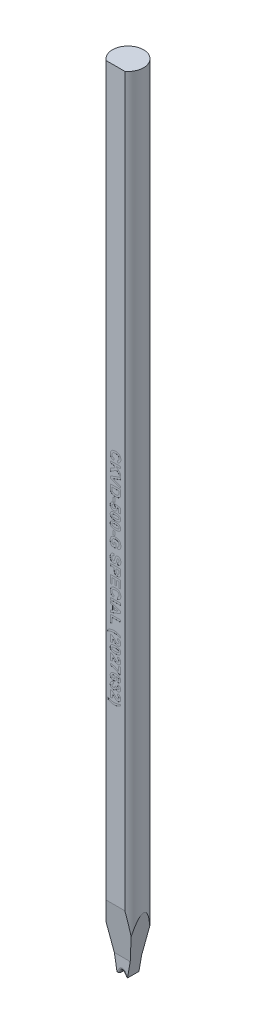
from build123d import *

# Parameters (mm, degrees)
SKETCH_TL_CUTTING_R       = 1.4986
TL_CUTTING_DEPTH          = 75.9968
SKETCH_TDF_GRINDING_W     = 3.0172
SKETCH_TDF_GRINDING_H     = 3.0172
TDF_GRINDING_DEPTH        = 77.026345527
SKETCH_ENGRAVING_W        = 0.166666667
SKETCH_ENGRAVING_H        = 0.371794872
SKETCH_ENGRAVING_W_2      = 1
SKETCH_ENGRAVING_H_2      = 0.192307693
ENGRAVING_DEPTH           = 0.005
VW_VR_GRINDING_DEPTH      = 1.5086
VW_VR_GRINDING_DEPTH_BACK = 1.5086
ISA_GRINDING_DEPTH        = 1.5086
ISA_GRINDING_DEPTH_BACK   = 1.5086
PRE_FRX_BRX_DEPTH         = 1.5086
PRE_FRX_BRX_DEPTH_BACK    = 1.5086
SKETCH_PRE_FRX_BRX_W      = 0.95742
SKETCH_PRE_FRX_BRX_H      = 1.4986
SKETCH_PRE_FRX_BRX_W_2    = 0.95996
FR_EDM_R                  = 0.24892
BR_EDM_R                  = 0.24892
FA_BA_GRINDING_DEPTH      = 1.5086
FA_BA_GRINDING_DEPTH_BACK = 1.5086


with BuildPart() as part:
    # sketch_TL_cutting → TL_cutting (new body)
    with BuildSketch(Plane(origin=(0, 0, 0), x_dir=(1, 0, 0), z_dir=(0, 1, 0))):
        Circle(SKETCH_TL_CUTTING_R)
    extrude(amount=TL_CUTTING_DEPTH)

    # sketch_TDF_grinding → TDF_grinding (cut, through all)
    with BuildSketch(Plane(origin=(0, 0, 0), x_dir=(1, 0, 0), z_dir=(0, 1, 0))):
        with Locations((0, -2.71002)):
            Rectangle(SKETCH_TDF_GRINDING_W, SKETCH_TDF_GRINDING_H)
    extrude(amount=TDF_GRINDING_DEPTH, mode=Mode.SUBTRACT)

    # sketch_engraving → engraving (cut)
    # profile 1 of 26: a face of its own
    with BuildSketch(Plane.XY.offset(1.20142)):
        with BuildLine():
            Line((-0.128205128, 43.253210256), (-0.192307692, 43.060902564))
            add(Edge.make_bspline(
                [(-0.192307692, 43.060902564), (-0.204917923, 43.064809052), (-0.229612721, 43.072459184), (-0.2649877, 43.086537804), (-0.297871332, 43.102532008), (-0.328259475, 43.120359875), (-0.356049464, 43.140095258), (-0.381471598, 43.161589244), (-0.404368127, 43.185053424), (-0.424673345, 43.210470624), (-0.442633936, 43.237563711), (-0.457816548, 43.266656053), (-0.470893242, 43.29731117), (-0.481488041, 43.329840557), (-0.489972889, 43.364028151), (-0.495577171, 43.400034413), (-0.499377062, 43.437690896), (-0.499789062, 43.463403283), (-0.5, 43.476567628)],
                knots=[0, 0, 0, 0, 1.126670901, 2.206376047, 3.246533763, 4.245677351, 5.210506282, 6.152793389, 7.083980095, 8.004497442, 8.926231833, 9.854395169, 10.801995143, 11.768203916, 12.771938831, 13.805609698, 14.87650608, 16, 16, 16, 16], degree=3))
            add(Edge.make_bspline(
                [(-0.5, 43.476567628), (-0.499663994, 43.492816309), (-0.499003061, 43.524777949), (-0.492350465, 43.571519052), (-0.481969511, 43.616060328), (-0.467601869, 43.658469613), (-0.448555271, 43.698448786), (-0.42571373, 43.736373108), (-0.398318662, 43.771809391), (-0.367249987, 43.804950716), (-0.332452821, 43.835079196), (-0.294134751, 43.861072297), (-0.253074131, 43.883610491), (-0.208709772, 43.901536594), (-0.161353037, 43.915621791), (-0.110975156, 43.925468328), (-0.057578507, 43.931634942), (-0.020984357, 43.932337083), (-0.002203526, 43.932697436)],
                knots=[0, 0, 0, 0, 1.025134988, 2.016471176, 2.973446247, 3.909197306, 4.836872559, 5.763618465, 6.698581235, 7.658772073, 8.627106982, 9.597494692, 10.576422683, 11.578339294, 12.6118974, 13.690673505, 14.814808564, 16, 16, 16, 16], degree=3))
            add(Edge.make_bspline(
                [(-0.002203526, 43.932697436), (0.017576475, 43.9323292), (0.056163648, 43.931610839), (0.112313555, 43.925562878), (0.165084042, 43.915516768), (0.214577853, 43.901940058), (0.260470573, 43.883729249), (0.303160692, 43.861873909), (0.342311169, 43.835756152), (0.377833814, 43.805831091), (0.409480853, 43.772697852), (0.437377469, 43.736993428), (0.460593243, 43.698491041), (0.479896446, 43.657667336), (0.494630503, 43.614223397), (0.505304611, 43.568276602), (0.511505561, 43.519806054), (0.512376199, 43.48666808), (0.512820513, 43.469756731)],
                knots=[0, 0, 0, 0, 1.212773307, 2.365899439, 3.458117515, 4.504331001, 5.50806732, 6.480562534, 7.440239902, 8.387651817, 9.323121479, 10.245404239, 11.160468186, 12.07454208, 13.009500751, 13.96802424, 14.963018902, 16, 16, 16, 16], degree=3))
            add(Edge.make_bspline(
                [(0.512820513, 43.469756731), (0.512448361, 43.454987276), (0.511718707, 43.426029796), (0.506761415, 43.383624506), (0.498061698, 43.343436158), (0.486319015, 43.305247521), (0.470821797, 43.269275987), (0.451884357, 43.235457111), (0.429606892, 43.203674651), (0.412205553, 43.184525065), (0.403445513, 43.174884936)],
                knots=[0, 0, 0, 0, 1.098510076, 2.153775193, 3.169777012, 4.153122333, 5.120892526, 6.076995459, 7.031936742, 8, 8, 8, 8], degree=3))
            add(Edge.make_bspline(
                [(0.403445513, 43.174884936), (0.39787141, 43.169297644), (0.386592274, 43.157991818), (0.367549896, 43.142895368), (0.347050772, 43.128582058), (0.324745215, 43.115279068), (0.30046466, 43.103406849), (0.274581981, 43.092394097), (0.246997406, 43.082255069), (0.227800247, 43.076616604), (0.217948718, 43.073723077)],
                knots=[0, 0, 0, 0, 0.885292881, 1.791380647, 2.722937556, 3.69093542, 4.703306561, 5.754477758, 6.847650944, 8, 8, 8, 8], degree=3))
            Line((0.217948718, 43.073723077), (0.179487179, 43.266030769))
            add(Edge.make_bspline(
                [(0.179487179, 43.266030769), (0.1857949, 43.267665288), (0.198219456, 43.270884861), (0.21607256, 43.27739955), (0.233014714, 43.284871208), (0.248625569, 43.2941361), (0.263619506, 43.303962074), (0.277222328, 43.315624773), (0.290109132, 43.328129754), (0.301694454, 43.342018861), (0.312145605, 43.356893589), (0.321339918, 43.372603983), (0.329014435, 43.389188478), (0.335156827, 43.406521754), (0.340319842, 43.424545702), (0.34350638, 43.443432147), (0.345953545, 43.463015752), (0.3460861, 43.476358875), (0.346153846, 43.483178205)],
                knots=[0, 0, 0, 0, 1.051114734, 2.070420253, 3.064047898, 4.034553068, 4.997066449, 5.953344811, 6.921213386, 7.892675544, 8.867420182, 9.852654213, 10.826683617, 11.811917648, 12.818610352, 13.848120519, 14.900229319, 16, 16, 16, 16], degree=3))
            add(Edge.make_bspline(
                [(0.346153846, 43.483178205), (0.345958725, 43.492542256), (0.345576529, 43.51088423), (0.341532101, 43.53761448), (0.335695112, 43.563055692), (0.326982094, 43.58711706), (0.315677399, 43.609731698), (0.302244603, 43.631228905), (0.286035184, 43.651060806), (0.26758257, 43.669699764), (0.246135655, 43.686407721), (0.221779967, 43.701110652), (0.194212535, 43.713304121), (0.163711493, 43.723204409), (0.130202077, 43.730996736), (0.093641969, 43.736561162), (0.054005962, 43.739638434), (0.026581025, 43.740133903), (0.012419872, 43.740389744)],
                knots=[0, 0, 0, 0, 0.93816214, 1.837638998, 2.704791736, 3.551915875, 4.396257554, 5.235807848, 6.087970119, 6.959042444, 7.860386085, 8.80649345, 9.804409709, 10.875695391, 12.017327537, 13.250155505, 14.580089023, 16, 16, 16, 16], degree=3))
            add(Edge.make_bspline(
                [(0.012419872, 43.740389744), (-0.002609028, 43.740136423), (-0.031567402, 43.739648312), (-0.073337178, 43.736571685), (-0.111754322, 43.730971705), (-0.14688701, 43.723282849), (-0.178713725, 43.713332973), (-0.207179389, 43.701159106), (-0.23231734, 43.686686701), (-0.254110839, 43.669938275), (-0.272831387, 43.651337256), (-0.288926796, 43.631387439), (-0.302688307, 43.610206524), (-0.314010391, 43.587667053), (-0.322575422, 43.563683298), (-0.328786932, 43.538452371), (-0.332735688, 43.511881695), (-0.333131326, 43.493675799), (-0.333333333, 43.484380128)],
                knots=[0, 0, 0, 0, 1.475208372, 2.842499301, 4.107722225, 5.282836115, 6.369007568, 7.375918121, 8.315702116, 9.208439171, 10.065831443, 10.90006451, 11.71996243, 12.54067204, 13.369972975, 14.214060185, 15.088124569, 16, 16, 16, 16], degree=3))
            add(Edge.make_bspline(
                [(-0.333333333, 43.484380128), (-0.333161634, 43.477497953), (-0.332824013, 43.463965176), (-0.330681155, 43.443962689), (-0.326591822, 43.42476438), (-0.321184418, 43.406276281), (-0.314399721, 43.388426559), (-0.305696319, 43.37148748), (-0.295693052, 43.355125777), (-0.283969989, 43.33968094), (-0.270808612, 43.324946156), (-0.255597341, 43.311507159), (-0.238701667, 43.299041373), (-0.220008678, 43.287706947), (-0.199678377, 43.27712516), (-0.177394008, 43.268122121), (-0.153515697, 43.259734984), (-0.136789345, 43.255423153), (-0.128205128, 43.253210256)],
                knots=[0, 0, 0, 0, 0.980177776, 1.927374078, 2.859849964, 3.771585772, 4.668674471, 5.574490016, 6.479656464, 7.396337719, 8.332153134, 9.288470092, 10.28125149, 11.318486971, 12.398724812, 13.541284404, 14.738150009, 16, 16, 16, 16], degree=3))
        make_face()
    # profile 2 of 26: a face of its own
    with BuildSketch(Plane.XY.offset(1.20142)):
        Polygon((-0.5, 42.894235897), (0.5, 42.894235897), (0.5, 42.701928205), (0.052283654, 42.701928205), (0.5, 42.280253526), (0.5, 42.016030769), (0.11338141, 42.395838462), (-0.5, 42.003210256), (-0.5, 42.259420192), (-0.035456731, 42.541671795), (-0.198517628, 42.701928205), (-0.5, 42.701928205), align=None)
    # profile 3 of 26: a face of its own
    with BuildSketch(Plane.XY.offset(1.20142)):
        Polygon((-0.5, 41.627008333), (0.5, 41.9968), (0.5, 41.793675), (-0.243589744, 41.528851282), (0.5, 41.265029167), (0.5, 41.060902564), (-0.5, 41.429291987), align=None)
    # profile 4 of 26: a face of its own
    with BuildSketch(Plane.XY.offset(1.20142)):
        with BuildLine():
            Line((0.5, 40.971158974), (0.5, 40.604372115))
            add(Edge.make_bspline(
                [(0.5, 40.604372115), (0.500005193, 40.594354571), (0.500015306, 40.574848084), (0.498840892, 40.546539066), (0.497659587, 40.520066494), (0.495294873, 40.495506352), (0.492816233, 40.472773432), (0.489678088, 40.451826942), (0.485656212, 40.432799202), (0.482484481, 40.420800319), (0.480969551, 40.415069231)],
                knots=[0, 0, 0, 0, 1.259756885, 2.453039283, 3.563158368, 4.591894114, 5.55549294, 6.43918076, 7.254497783, 8, 8, 8, 8], degree=3))
            add(Edge.make_bspline(
                [(0.480969551, 40.415069231), (0.478637325, 40.407900254), (0.474014881, 40.393691431), (0.465827813, 40.372838378), (0.455960096, 40.353004479), (0.445111978, 40.333729819), (0.432903728, 40.315457553), (0.419595761, 40.297742873), (0.404753223, 40.281109803), (0.383633179, 40.25957514), (0.35420815, 40.235150255), (0.315375005, 40.20931972), (0.272594656, 40.187582014), (0.234409605, 40.172390641), (0.20183843, 40.162346542), (0.175754603, 40.155778141), (0.148301213, 40.150106468), (0.119383738, 40.145856292), (0.08913491, 40.142194906), (0.057465542, 40.139567238), (0.024383276, 40.13826625), (0.001870575, 40.137974494), (-0.009615385, 40.137825641)],
                knots=[0, 0, 0, 0, 0.745431882, 1.477436776, 2.212739876, 2.934276521, 3.663147754, 4.384200836, 5.123377481, 5.865761747, 7.365547505, 8.894711587, 10.468722596, 12.101948761, 12.951987285, 13.837595333, 14.760899389, 15.722756883, 16.726861385, 17.773652936, 18.864119771, 20, 20, 20, 20], degree=3))
            add(Edge.make_bspline(
                [(-0.009615385, 40.137825641), (-0.0294616, 40.138217046), (-0.067834928, 40.13897384), (-0.123301552, 40.144571211), (-0.17465514, 40.153866648), (-0.206804138, 40.163577075), (-0.222355769, 40.168274359)],
                knots=[0, 0, 0, 0, 1.103491527, 2.133638164, 3.0971734, 4, 4, 4, 4], degree=3))
            add(Edge.make_bspline(
                [(-0.222355769, 40.168274359), (-0.231274521, 40.171448003), (-0.248819098, 40.177691057), (-0.274127236, 40.188615932), (-0.298211673, 40.200420337), (-0.321053432, 40.213202184), (-0.342549771, 40.227026052), (-0.362636394, 40.241943645), (-0.381577746, 40.257723731), (-0.393236239, 40.26915549), (-0.399038462, 40.274844872)],
                knots=[0, 0, 0, 0, 1.090884612, 2.145940218, 3.175104604, 4.181306866, 5.161203701, 6.118658341, 7.063689906, 8, 8, 8, 8], degree=3))
            add(Edge.make_bspline(
                [(-0.399038462, 40.274844872), (-0.407300305, 40.284131145), (-0.424264154, 40.303198431), (-0.445652736, 40.33654995), (-0.464086504, 40.374425276), (-0.473760833, 40.401739168), (-0.478766026, 40.415870513)],
                knots=[0, 0, 0, 0, 0.912008655, 1.872605891, 2.89935344, 4, 4, 4, 4], degree=3))
            add(Edge.make_bspline(
                [(-0.478766026, 40.415870513), (-0.4805228, 40.421590486), (-0.484168894, 40.433461996), (-0.488062998, 40.452285444), (-0.492165475, 40.472379947), (-0.49463687, 40.493977223), (-0.497243066, 40.516853081), (-0.498706299, 40.541189822), (-0.49974511, 40.566903081), (-0.499913777, 40.584539175), (-0.5, 40.593554808)],
                knots=[0, 0, 0, 0, 0.799129865, 1.658552685, 2.566799617, 3.538529252, 4.561352959, 5.643373779, 6.795284424, 8, 8, 8, 8], degree=3))
            Line((-0.5, 40.593554808), (-0.5, 40.971158974))
            Line((-0.5, 40.971158974), (0.5, 40.971158974))
        make_face()
        with BuildLine():
            Line((0.333333333, 40.778851282), (-0.333333333, 40.778851282))
            Line((-0.333333333, 40.778851282), (-0.333333333, 40.620598077))
            add(Edge.make_bspline(
                [(-0.333333333, 40.620598077), (-0.333276671, 40.61345336), (-0.333167574, 40.599697049), (-0.332847006, 40.579791316), (-0.331979167, 40.561498115), (-0.331080228, 40.544721614), (-0.329595022, 40.52950549), (-0.328134266, 40.515783535), (-0.326090699, 40.503632132), (-0.324477534, 40.496127127), (-0.323717949, 40.492593269)],
                knots=[0, 0, 0, 0, 1.333384787, 2.567275092, 3.714769766, 4.750907381, 5.701951617, 6.567520054, 7.325492842, 8, 8, 8, 8], degree=3))
            add(Edge.make_bspline(
                [(-0.323717949, 40.492593269), (-0.321509316, 40.484316575), (-0.317207482, 40.468195757), (-0.307617456, 40.445560499), (-0.296048139, 40.425078507), (-0.282136533, 40.40640677), (-0.26455548, 40.38957967), (-0.242070693, 40.375215683), (-0.215254411, 40.361922192), (-0.189584523, 40.352818806), (-0.16665678, 40.346284413), (-0.147412959, 40.341861165), (-0.126593091, 40.338365591), (-0.104279343, 40.335358942), (-0.080500412, 40.332929499), (-0.055170426, 40.331417784), (-0.028320392, 40.330386029), (-0.009883527, 40.330219161), (-0.000400641, 40.330133333)],
                knots=[0, 0, 0, 0, 1.038686998, 2.023088296, 2.974059649, 3.888265163, 4.839857954, 5.909819677, 7.113156087, 8.466843969, 9.20827164, 10.006482943, 10.861893492, 11.769681931, 12.739021491, 13.762258324, 14.849031541, 16, 16, 16, 16], degree=3))
            add(Edge.make_bspline(
                [(-0.000400641, 40.330133333), (0.009082275, 40.3302185), (0.027452469, 40.330383485), (0.054102292, 40.331413664), (0.079033415, 40.332916863), (0.102276578, 40.335363691), (0.123864169, 40.338323456), (0.143813574, 40.341860891), (0.161996804, 40.346254423), (0.183589283, 40.352807511), (0.207947697, 40.362644996), (0.23429421, 40.376471199), (0.2571147, 40.392736402), (0.276689574, 40.411091558), (0.29287817, 40.432178569), (0.306422028, 40.455549371), (0.316938162, 40.481680279), (0.321416742, 40.500269318), (0.323717949, 40.509820833)],
                knots=[0, 0, 0, 0, 1.118059345, 2.165891593, 3.144157881, 4.062285166, 4.920717571, 5.712910489, 6.449981617, 7.12489426, 8.371943983, 9.541298068, 10.624898781, 11.666293176, 12.69306237, 13.747704633, 14.842713931, 16, 16, 16, 16], degree=3))
            add(Edge.make_bspline(
                [(0.323717949, 40.509820833), (0.324486218, 40.513955143), (0.326177652, 40.523057311), (0.328151987, 40.538161571), (0.329628909, 40.555948179), (0.331099472, 40.576377116), (0.331977905, 40.599427064), (0.332859431, 40.625132571), (0.333166326, 40.653516851), (0.333276065, 40.673349207), (0.333333333, 40.683699038)],
                knots=[0, 0, 0, 0, 0.578739524, 1.274162912, 2.095457587, 3.035141998, 4.093102578, 5.270121571, 6.575369351, 8, 8, 8, 8], degree=3))
            Line((0.333333333, 40.683699038), (0.333333333, 40.778851282))
        make_face(mode=Mode.SUBTRACT)
    # profile 5 of 26: a face of its own
    with BuildSketch(Plane.XY.offset(1.20142)):
        with Locations((-0.147435898, 39.810902564)):
            Rectangle(SKETCH_ENGRAVING_W, SKETCH_ENGRAVING_H)
    # profile 6 of 26: a face of its own
    with BuildSketch(Plane.XY.offset(1.20142)):
        with BuildLine():
            Line((-0.213942308, 39.560902564), (-0.192307692, 39.394235897))
            add(Edge.make_bspline(
                [(-0.192307692, 39.394235897), (-0.203607347, 39.392386826), (-0.225366694, 39.388826133), (-0.255826929, 39.377863828), (-0.282470914, 39.362235917), (-0.305088238, 39.342561759), (-0.323334969, 39.320118846), (-0.336523954, 39.295449962), (-0.344692684, 39.269080099), (-0.34566455, 39.250796649), (-0.346153846, 39.241591667)],
                knots=[0, 0, 0, 0, 1.155217688, 2.224562036, 3.249849536, 4.259092678, 5.238040954, 6.15568152, 7.071459712, 8, 8, 8, 8], degree=3))
            add(Edge.make_bspline(
                [(-0.346153846, 39.241591667), (-0.346059894, 39.236243112), (-0.34587598, 39.225773234), (-0.34378776, 39.210344535), (-0.340396301, 39.19560521), (-0.335789422, 39.181418977), (-0.329745146, 39.167921981), (-0.322266898, 39.15509854), (-0.313608966, 39.14279075), (-0.303697677, 39.131155274), (-0.29215854, 39.12071258), (-0.27939506, 39.111438023), (-0.265101057, 39.103850338), (-0.249674797, 39.097308976), (-0.232663378, 39.092681315), (-0.214481969, 39.088969692), (-0.194883734, 39.087084068), (-0.18142672, 39.086727617), (-0.174479167, 39.08654359)],
                knots=[0, 0, 0, 0, 0.98109136, 1.920501424, 2.850996269, 3.75396817, 4.653607445, 5.559568228, 6.474190795, 7.412641135, 8.358186253, 9.324081521, 10.300185094, 11.322066343, 12.392681767, 13.529496655, 14.72453472, 16, 16, 16, 16], degree=3))
            add(Edge.make_bspline(
                [(-0.174479167, 39.08654359), (-0.167930185, 39.086647549), (-0.155273198, 39.086848469), (-0.136935362, 39.08871253), (-0.119798482, 39.091573852), (-0.103987864, 39.096125768), (-0.089209555, 39.101324403), (-0.075987454, 39.108333513), (-0.063746794, 39.116024163), (-0.053149329, 39.12539838), (-0.04378212, 39.135610732), (-0.035449479, 39.146493065), (-0.028416647, 39.158190594), (-0.022600846, 39.17059263), (-0.018105451, 39.183752809), (-0.015265585, 39.197699831), (-0.013079926, 39.212277064), (-0.012907894, 39.222285328), (-0.012820513, 39.22736891)],
                knots=[0, 0, 0, 0, 1.292262537, 2.497510385, 3.635136149, 4.715991128, 5.741845981, 6.720379908, 7.663568786, 8.58853187, 9.502632107, 10.396263742, 11.289117461, 12.191261909, 13.095714127, 14.026387781, 14.997526353, 16, 16, 16, 16], degree=3))
            add(Edge.make_bspline(
                [(-0.012820513, 39.22736891), (-0.013050924, 39.233795741), (-0.013510598, 39.24661737), (-0.017247301, 39.265544398), (-0.02333068, 39.28396685), (-0.031799166, 39.301865577), (-0.042720432, 39.319193226), (-0.056130694, 39.335874776), (-0.071799231, 39.352196575), (-0.083638008, 39.362222371), (-0.08974359, 39.367392949)],
                knots=[0, 0, 0, 0, 0.931687088, 1.85873035, 2.786835662, 3.740075265, 4.723687035, 5.750832598, 6.840042753, 8, 8, 8, 8], degree=3))
            Line((-0.08974359, 39.367392949), (-0.066105769, 39.535261538))
            Line((-0.066105769, 39.535261538), (0.487179487, 39.419876923))
            Line((0.487179487, 39.419876923), (0.487179487, 38.932697436))
            Line((0.487179487, 38.932697436), (0.294871795, 38.932697436))
            Line((0.294871795, 38.932697436), (0.294871795, 39.265630128))
            Line((0.294871795, 39.265630128), (0.116386218, 39.304892949))
            add(Edge.make_bspline(
                [(0.116386218, 39.304892949), (0.122158957, 39.294887656), (0.133400829, 39.275403282), (0.144973305, 39.24429635), (0.152400706, 39.213029621), (0.153366831, 39.191952487), (0.153846154, 39.181495513)],
                knots=[0, 0, 0, 0, 1.060051984, 2.064352337, 3.039669322, 4, 4, 4, 4], degree=3))
            add(Edge.make_bspline(
                [(0.153846154, 39.181495513), (0.153581613, 39.171665068), (0.153059042, 39.152246132), (0.148771515, 39.123766641), (0.141705229, 39.096449395), (0.131871753, 39.07020215), (0.118982632, 39.045212644), (0.103404168, 39.021265451), (0.084866032, 38.998706296), (0.063903438, 38.977292789), (0.04071085, 38.957765174), (0.015420507, 38.940901525), (-0.011337699, 38.926336215), (-0.039859413, 38.914478326), (-0.070184315, 38.905548996), (-0.102051282, 38.89886179), (-0.135661543, 38.895115665), (-0.158578281, 38.894533149), (-0.170272436, 38.894235897)],
                knots=[0, 0, 0, 0, 0.974409932, 1.924837087, 2.848242317, 3.768103797, 4.697919751, 5.630842317, 6.595644344, 7.588240789, 8.59876155, 9.595918743, 10.597287627, 11.615415169, 12.652315553, 13.727511434, 14.840374562, 16, 16, 16, 16], degree=3))
            add(Edge.make_bspline(
                [(-0.170272436, 38.894235897), (-0.180095164, 38.89450219), (-0.199591316, 38.895030727), (-0.228431015, 38.898174662), (-0.256480502, 38.903884756), (-0.283660862, 38.911692183), (-0.310181667, 38.92153598), (-0.335760069, 38.933779792), (-0.360613268, 38.948272719), (-0.376286294, 38.959479985), (-0.384214744, 38.965149359)],
                knots=[0, 0, 0, 0, 1.0275977, 2.039576086, 3.029943557, 4.018141221, 4.995043124, 5.985410594, 6.980887897, 8, 8, 8, 8], degree=3))
            add(Edge.make_bspline(
                [(-0.384214744, 38.965149359), (-0.39442561, 38.973410871), (-0.414521783, 38.989670487), (-0.440928765, 39.017512796), (-0.463196136, 39.047810934), (-0.481238657, 39.080534524), (-0.495700415, 39.115411763), (-0.505577236, 39.152807561), (-0.511741284, 39.19244131), (-0.51245553, 39.219666597), (-0.512820513, 39.233578846)],
                knots=[0, 0, 0, 0, 1.018155984, 2.003849412, 2.967446846, 3.927472908, 4.896208823, 5.888955604, 6.921246412, 8, 8, 8, 8], degree=3))
            add(Edge.make_bspline(
                [(-0.512820513, 39.233578846), (-0.51261689, 39.244807919), (-0.512219305, 39.266733296), (-0.508313832, 39.298846963), (-0.50189785, 39.329325845), (-0.493201931, 39.358314952), (-0.481586571, 39.385539005), (-0.467806969, 39.411332218), (-0.451267563, 39.435497806), (-0.432181131, 39.457893624), (-0.411081442, 39.478457914), (-0.387995531, 39.496800686), (-0.363308362, 39.51312086), (-0.336770788, 39.527107199), (-0.308568836, 39.539026858), (-0.278557994, 39.548517794), (-0.246938394, 39.556332152), (-0.225062746, 39.55936223), (-0.213942308, 39.560902564)],
                knots=[0, 0, 0, 0, 1.098896741, 2.145655864, 3.16104256, 4.145315902, 5.10323158, 6.053780891, 7.003858069, 7.963890296, 8.930045353, 9.883557002, 10.846278307, 11.82296847, 12.816080213, 13.83936887, 14.901647787, 16, 16, 16, 16], degree=3))
        make_face()
    # profile 7 of 26: a face of its own
    with BuildSketch(Plane.XY.offset(1.20142)):
        with BuildLine():
            add(Edge.make_bspline(
                [(0.5, 38.464748718), (0.49971384, 38.452844998), (0.499156721, 38.429669821), (0.494192381, 38.395907508), (0.486315205, 38.364154925), (0.474936732, 38.334405943), (0.460535804, 38.306509267), (0.442472771, 38.280857415), (0.421624591, 38.25685643), (0.405435577, 38.243000797), (0.397235577, 38.235982692)],
                knots=[0, 0, 0, 0, 1.098626248, 2.138899374, 3.143835643, 4.113754749, 5.073488057, 6.034745239, 7.004566348, 8, 8, 8, 8], degree=3))
            add(Edge.make_bspline(
                [(0.397235577, 38.235982692), (0.392013767, 38.231967993), (0.381356969, 38.223774695), (0.364136726, 38.21274029), (0.345869985, 38.202131685), (0.326116385, 38.192873442), (0.305221356, 38.184000078), (0.283126793, 38.175809313), (0.259707844, 38.16857695), (0.235071142, 38.162272124), (0.209179241, 38.156378627), (0.181968999, 38.151441398), (0.15350924, 38.147215972), (0.123831018, 38.143920738), (0.092992495, 38.140966339), (0.060842825, 38.139349757), (0.027454838, 38.138025267), (0.004742429, 38.137892949), (-0.006810897, 38.137825641)],
                knots=[0, 0, 0, 0, 0.746775751, 1.524038446, 2.317840886, 3.141016509, 3.996283186, 4.892488336, 5.812382473, 6.774967264, 7.776368117, 8.823659909, 9.910833035, 11.039122168, 12.210293276, 13.424012874, 14.68964937, 16, 16, 16, 16], degree=3))
            add(Edge.make_bspline(
                [(-0.006810897, 38.137825641), (-0.01836425, 38.137891934), (-0.041009977, 38.138021876), (-0.074330982, 38.139354693), (-0.106413621, 38.140967781), (-0.13725379, 38.143913853), (-0.166926114, 38.147240728), (-0.195353975, 38.151346272), (-0.22243919, 38.156664764), (-0.248289812, 38.162471418), (-0.27303117, 38.168736077), (-0.296407841, 38.1762899), (-0.318777777, 38.184150303), (-0.339699687, 38.193229898), (-0.359477735, 38.202820372), (-0.377930928, 38.213271112), (-0.395257891, 38.224428726), (-0.40597091, 38.232701289), (-0.411258013, 38.236783974)],
                knots=[0, 0, 0, 0, 1.308411734, 2.564617834, 3.776541518, 4.94597967, 6.0725993, 7.15816376, 8.197872509, 9.197791611, 10.158952087, 11.086962723, 11.979249638, 12.843171697, 13.668427753, 14.467630577, 15.243743175, 16, 16, 16, 16], degree=3))
            add(Edge.make_bspline(
                [(-0.411258013, 38.236783974), (-0.419387722, 38.243737875), (-0.435436162, 38.257465209), (-0.456111536, 38.281200465), (-0.473801555, 38.3068109), (-0.487914093, 38.334657064), (-0.499368982, 38.364261236), (-0.506993451, 38.396065546), (-0.511967929, 38.429735616), (-0.512532265, 38.452911213), (-0.512820513, 38.464748718)],
                knots=[0, 0, 0, 0, 0.991667276, 1.957599061, 2.911530233, 3.873218945, 4.847995157, 5.850445929, 6.902062539, 8, 8, 8, 8], degree=3))
            add(Edge.make_bspline(
                [(-0.512820513, 38.464748718), (-0.512476011, 38.476721133), (-0.511800941, 38.500181702), (-0.506449472, 38.534435149), (-0.497876451, 38.566994622), (-0.485636462, 38.597743234), (-0.469774335, 38.626636989), (-0.45076002, 38.653901616), (-0.427732542, 38.678943948), (-0.40629523, 38.698549361), (-0.386925042, 38.712892741), (-0.37086259, 38.723009036), (-0.353675124, 38.732785358), (-0.33482528, 38.741223499), (-0.314870578, 38.749548475), (-0.293380967, 38.756921787), (-0.270541238, 38.763426959), (-0.246455682, 38.769534901), (-0.220958398, 38.774628025), (-0.194124629, 38.779312952), (-0.165840258, 38.783004927), (-0.136262825, 38.786278243), (-0.105322509, 38.788582844), (-0.073069943, 38.790454475), (-0.039401887, 38.791392969), (-0.01649349, 38.791577608), (-0.004807692, 38.791671795)],
                knots=[0, 0, 0, 0, 1.257818097, 2.464759732, 3.634271214, 4.790227596, 5.933394726, 7.09190477, 8.274482889, 9.50191983, 10.139172818, 10.805000628, 11.49619854, 12.215266328, 12.973768034, 13.768328009, 14.601232062, 15.469317089, 16.379095881, 17.333267023, 18.331755967, 19.376479622, 20.460535752, 21.592206075, 22.771760786, 24, 24, 24, 24], degree=3))
            add(Edge.make_bspline(
                [(-0.004807692, 38.791671795), (0.006678925, 38.791606), (0.02919122, 38.791477052), (0.062378132, 38.790134948), (0.094328674, 38.788541634), (0.12509981, 38.78556902), (0.154640959, 38.782269515), (0.183004063, 38.778156894), (0.209982531, 38.772738814), (0.235876189, 38.767389743), (0.260431507, 38.760649782), (0.2837906, 38.753224475), (0.306110518, 38.745390136), (0.326924245, 38.736217854), (0.346659803, 38.726682898), (0.365109758, 38.716224838), (0.382437536, 38.705069066), (0.39315045, 38.696796265), (0.3984375, 38.692713462)],
                knots=[0, 0, 0, 0, 1.304443357, 2.556541329, 3.771813033, 4.936929721, 6.066661712, 7.147723817, 8.190304831, 9.191350322, 10.149780912, 11.080355239, 11.975107155, 12.834450748, 13.66198663, 14.463397305, 15.241653965, 16, 16, 16, 16], degree=3))
            add(Edge.make_bspline(
                [(0.3984375, 38.692713462), (0.406566428, 38.685759179), (0.422613323, 38.672031089), (0.443299998, 38.648301361), (0.460913987, 38.622719209), (0.475197493, 38.594954301), (0.486497465, 38.565282107), (0.494183265, 38.533436121), (0.499144648, 38.499760686), (0.499710816, 38.476585839), (0.5, 38.464748718)],
                knots=[0, 0, 0, 0, 0.991631672, 1.957528776, 2.911425699, 3.867574088, 4.848108326, 5.850523106, 6.902101959, 8, 8, 8, 8], degree=3))
        make_face()
        with BuildLine():
            add(Edge.make_bspline(
                [(0.333333333, 38.464748718), (0.333068079, 38.470916684), (0.332548986, 38.482987158), (0.328316127, 38.500542094), (0.321759633, 38.517123165), (0.312130705, 38.532681206), (0.299093083, 38.54708978), (0.281476094, 38.559297658), (0.259881539, 38.569851162), (0.243736, 38.575130771), (0.235176282, 38.577929808)],
                knots=[0, 0, 0, 0, 0.909107913, 1.77908945, 2.650019014, 3.530482969, 4.465025013, 5.495890128, 6.672421267, 8, 8, 8, 8], degree=3))
            add(Edge.make_bspline(
                [(0.235176282, 38.577929808), (0.228718042, 38.579677997), (0.214837576, 38.583435317), (0.192206647, 38.58769972), (0.166522939, 38.591216485), (0.137792419, 38.594186038), (0.105999886, 38.596602628), (0.071125109, 38.598090848), (0.033192525, 38.599119478), (0.006878451, 38.599280391), (-0.006810897, 38.599364103)],
                knots=[0, 0, 0, 0, 0.658986521, 1.416336438, 2.266694271, 3.212608458, 4.261595115, 5.407496572, 6.651304179, 8, 8, 8, 8], degree=3))
            add(Edge.make_bspline(
                [(-0.006810897, 38.599364103), (-0.020433943, 38.599373117), (-0.046549094, 38.599390397), (-0.084006477, 38.598216163), (-0.118154033, 38.59704872), (-0.148991056, 38.594679061), (-0.176626244, 38.592340892), (-0.200847568, 38.588803343), (-0.221857789, 38.585250608), (-0.244486895, 38.579217153), (-0.268257705, 38.570901394), (-0.292448985, 38.559672977), (-0.311537375, 38.547007058), (-0.325415776, 38.532475587), (-0.334597404, 38.516730329), (-0.341538269, 38.500426395), (-0.345246665, 38.482874555), (-0.345848983, 38.470840013), (-0.346153846, 38.464748718)],
                knots=[0, 0, 0, 0, 1.613038927, 3.092168624, 4.43749063, 5.658264602, 6.75425577, 7.720394221, 8.556328411, 9.275513998, 10.490872946, 11.534172084, 12.42681833, 13.187531851, 13.88996177, 14.574222125, 15.278341114, 16, 16, 16, 16], degree=3))
            add(Edge.make_bspline(
                [(-0.346153846, 38.464748718), (-0.345874419, 38.45865088), (-0.345321688, 38.446588799), (-0.341225408, 38.429056833), (-0.334465655, 38.412499336), (-0.325029126, 38.396836493), (-0.311901617, 38.38241441), (-0.294300445, 38.370197614), (-0.272700888, 38.35964693), (-0.25655611, 38.354366893), (-0.247996795, 38.351567628)],
                knots=[0, 0, 0, 0, 0.899391665, 1.779078861, 2.640979247, 3.529945348, 4.464599804, 5.495588918, 6.672261578, 8, 8, 8, 8], degree=3))
            add(Edge.make_bspline(
                [(-0.247996795, 38.351567628), (-0.241538043, 38.349821968), (-0.227719754, 38.346087186), (-0.205229709, 38.341792396), (-0.179679092, 38.33826611), (-0.151079269, 38.335324791), (-0.11935541, 38.332884431), (-0.084546407, 38.331408845), (-0.046680798, 38.330379247), (-0.020433482, 38.330217356), (-0.006810897, 38.330133333)],
                knots=[0, 0, 0, 0, 0.66114423, 1.414496391, 2.261103113, 3.210114492, 4.255954433, 5.405607896, 6.653488082, 8, 8, 8, 8], degree=3))
            add(Edge.make_bspline(
                [(-0.006810897, 38.330133333), (0.006810741, 38.330247109), (0.032921137, 38.330465199), (0.070464093, 38.331092091), (0.104645163, 38.332847006), (0.13553417, 38.334603226), (0.163028833, 38.337568631), (0.187277888, 38.340511537), (0.208178651, 38.344583667), (0.23096624, 38.350175697), (0.254848985, 38.35851368), (0.278913284, 38.37008584), (0.298191428, 38.38252291), (0.312146257, 38.397029879), (0.321683592, 38.412748044), (0.328364426, 38.429200374), (0.332523972, 38.446649531), (0.333060584, 38.45864941), (0.333333333, 38.464748718)],
                knots=[0, 0, 0, 0, 1.611458614, 3.088895909, 4.441089836, 5.660086535, 6.747875232, 7.711965119, 8.548505902, 9.26500436, 10.486583113, 11.532259092, 12.419544583, 13.184925779, 13.890764661, 14.581638641, 15.279074115, 16, 16, 16, 16], degree=3))
        make_face(mode=Mode.SUBTRACT)
    # profile 8 of 26: a face of its own
    with BuildSketch(Plane.XY.offset(1.20142)):
        with BuildLine():
            add(Edge.make_bspline(
                [(0.5, 37.695517949), (0.49971384, 37.683614229), (0.499156721, 37.660439051), (0.494192381, 37.626676739), (0.486315205, 37.594924156), (0.474936732, 37.565175173), (0.460535804, 37.537278497), (0.442472771, 37.511626646), (0.421624591, 37.487625661), (0.405435577, 37.473770028), (0.397235577, 37.466751923)],
                knots=[0, 0, 0, 0, 1.098626248, 2.138899374, 3.143835643, 4.113754749, 5.073488057, 6.034745239, 7.004566348, 8, 8, 8, 8], degree=3))
            add(Edge.make_bspline(
                [(0.397235577, 37.466751923), (0.392013767, 37.462737224), (0.381356969, 37.454543926), (0.364136726, 37.44350952), (0.345869985, 37.432900915), (0.326116385, 37.423642673), (0.305221356, 37.414769309), (0.283126793, 37.406578544), (0.259707844, 37.39934618), (0.235071142, 37.393041354), (0.209179241, 37.387147858), (0.181968999, 37.382210628), (0.15350924, 37.377985203), (0.123831018, 37.374689969), (0.092992495, 37.37173557), (0.060842825, 37.370118988), (0.027454838, 37.368794498), (0.004742429, 37.368662179), (-0.006810897, 37.368594872)],
                knots=[0, 0, 0, 0, 0.746775751, 1.524038446, 2.317840886, 3.141016509, 3.996283186, 4.892488336, 5.812382473, 6.774967264, 7.776368117, 8.823659909, 9.910833035, 11.039122168, 12.210293276, 13.424012874, 14.68964937, 16, 16, 16, 16], degree=3))
            add(Edge.make_bspline(
                [(-0.006810897, 37.368594872), (-0.01836425, 37.368661165), (-0.041009977, 37.368791107), (-0.074330982, 37.370123924), (-0.106413621, 37.371737012), (-0.13725379, 37.374683084), (-0.166926114, 37.378009959), (-0.195353975, 37.382115503), (-0.22243919, 37.387433995), (-0.248289812, 37.393240649), (-0.27303117, 37.399505308), (-0.296407841, 37.407059131), (-0.318777777, 37.414919533), (-0.339699687, 37.423999129), (-0.359477735, 37.433589602), (-0.377930928, 37.444040342), (-0.395257891, 37.455197957), (-0.40597091, 37.46347052), (-0.411258013, 37.467553205)],
                knots=[0, 0, 0, 0, 1.308411734, 2.564617834, 3.776541518, 4.94597967, 6.0725993, 7.15816376, 8.197872509, 9.197791611, 10.158952087, 11.086962723, 11.979249638, 12.843171697, 13.668427753, 14.467630577, 15.243743175, 16, 16, 16, 16], degree=3))
            add(Edge.make_bspline(
                [(-0.411258013, 37.467553205), (-0.419387722, 37.474507105), (-0.435436162, 37.48823444), (-0.456111536, 37.511969695), (-0.473801555, 37.537580131), (-0.487914093, 37.565426295), (-0.499368982, 37.595030467), (-0.506993451, 37.626834777), (-0.511967929, 37.660504847), (-0.512532265, 37.683680444), (-0.512820513, 37.695517949)],
                knots=[0, 0, 0, 0, 0.991667276, 1.957599061, 2.911530233, 3.873218945, 4.847995157, 5.850445929, 6.902062539, 8, 8, 8, 8], degree=3))
            add(Edge.make_bspline(
                [(-0.512820513, 37.695517949), (-0.512476011, 37.707490364), (-0.511800941, 37.730950933), (-0.506449472, 37.765204379), (-0.497876451, 37.797763853), (-0.485636462, 37.828512465), (-0.469774335, 37.85740622), (-0.45076002, 37.884670847), (-0.427732542, 37.909713179), (-0.40629523, 37.929318592), (-0.386925042, 37.943661971), (-0.37086259, 37.953778267), (-0.353675124, 37.963554589), (-0.33482528, 37.97199273), (-0.314870578, 37.980317706), (-0.293380967, 37.987691018), (-0.270541238, 37.99419619), (-0.246455682, 38.000304132), (-0.220958398, 38.005397256), (-0.194124629, 38.010082183), (-0.165840258, 38.013774157), (-0.136262825, 38.017047473), (-0.105322509, 38.019352075), (-0.073069943, 38.021223706), (-0.039401887, 38.0221622), (-0.01649349, 38.022346839), (-0.004807692, 38.022441026)],
                knots=[0, 0, 0, 0, 1.257818097, 2.464759732, 3.634271214, 4.790227596, 5.933394726, 7.09190477, 8.274482889, 9.50191983, 10.139172818, 10.805000628, 11.49619854, 12.215266328, 12.973768034, 13.768328009, 14.601232062, 15.469317089, 16.379095881, 17.333267023, 18.331755967, 19.376479622, 20.460535752, 21.592206075, 22.771760786, 24, 24, 24, 24], degree=3))
            add(Edge.make_bspline(
                [(-0.004807692, 38.022441026), (0.006678925, 38.022375231), (0.02919122, 38.022246282), (0.062378132, 38.020904179), (0.094328674, 38.019310865), (0.12509981, 38.016338251), (0.154640959, 38.013038746), (0.183004063, 38.008926125), (0.209982531, 38.003508045), (0.235876189, 37.998158974), (0.260431507, 37.991419013), (0.2837906, 37.983993706), (0.306110518, 37.976159367), (0.326924245, 37.966987084), (0.346659803, 37.957452128), (0.365109758, 37.946994069), (0.382437536, 37.935838297), (0.39315045, 37.927565495), (0.3984375, 37.923482692)],
                knots=[0, 0, 0, 0, 1.304443357, 2.556541329, 3.771813033, 4.936929721, 6.066661712, 7.147723817, 8.190304831, 9.191350322, 10.149780912, 11.080355239, 11.975107155, 12.834450748, 13.66198663, 14.463397305, 15.241653965, 16, 16, 16, 16], degree=3))
            add(Edge.make_bspline(
                [(0.3984375, 37.923482692), (0.406566428, 37.91652841), (0.422613323, 37.90280032), (0.443299998, 37.879070592), (0.460913987, 37.853488439), (0.475197493, 37.825723532), (0.486497465, 37.796051338), (0.494183265, 37.764205352), (0.499144648, 37.730529916), (0.499710816, 37.70735507), (0.5, 37.695517949)],
                knots=[0, 0, 0, 0, 0.991631672, 1.957528776, 2.911425699, 3.867574088, 4.848108326, 5.850523106, 6.902101959, 8, 8, 8, 8], degree=3))
        make_face()
        with BuildLine():
            add(Edge.make_bspline(
                [(0.333333333, 37.695517949), (0.333068079, 37.701685915), (0.332548986, 37.713756389), (0.328316127, 37.731311325), (0.321759633, 37.747892396), (0.312130705, 37.763450436), (0.299093083, 37.777859011), (0.281476094, 37.790066888), (0.259881539, 37.800620392), (0.243736, 37.805900001), (0.235176282, 37.808699038)],
                knots=[0, 0, 0, 0, 0.909107913, 1.77908945, 2.650019014, 3.530482969, 4.465025013, 5.495890128, 6.672421267, 8, 8, 8, 8], degree=3))
            add(Edge.make_bspline(
                [(0.235176282, 37.808699038), (0.228718042, 37.810447227), (0.214837576, 37.814204548), (0.192206647, 37.818468951), (0.166522939, 37.821985716), (0.137792419, 37.824955269), (0.105999886, 37.827371859), (0.071125109, 37.828860078), (0.033192525, 37.829888709), (0.006878451, 37.830049622), (-0.006810897, 37.830133333)],
                knots=[0, 0, 0, 0, 0.658986521, 1.416336438, 2.266694271, 3.212608458, 4.261595115, 5.407496572, 6.651304179, 8, 8, 8, 8], degree=3))
            add(Edge.make_bspline(
                [(-0.006810897, 37.830133333), (-0.020433943, 37.830142347), (-0.046549094, 37.830159627), (-0.084006477, 37.828985394), (-0.118154033, 37.827817951), (-0.148991056, 37.825448292), (-0.176626244, 37.823110123), (-0.200847568, 37.819572574), (-0.221857789, 37.816019839), (-0.244486895, 37.809986384), (-0.268257705, 37.801670625), (-0.292448985, 37.790442207), (-0.311537375, 37.777776289), (-0.325415776, 37.763244818), (-0.334597404, 37.74749956), (-0.341538269, 37.731195625), (-0.345246665, 37.713643786), (-0.345848983, 37.701609244), (-0.346153846, 37.695517949)],
                knots=[0, 0, 0, 0, 1.613038927, 3.092168624, 4.43749063, 5.658264602, 6.75425577, 7.720394221, 8.556328411, 9.275513998, 10.490872946, 11.534172084, 12.42681833, 13.187531851, 13.88996177, 14.574222125, 15.278341114, 16, 16, 16, 16], degree=3))
            add(Edge.make_bspline(
                [(-0.346153846, 37.695517949), (-0.345874419, 37.689420111), (-0.345321688, 37.67735803), (-0.341225408, 37.659826063), (-0.334465655, 37.643268567), (-0.325029126, 37.627605723), (-0.311901617, 37.613183641), (-0.294300445, 37.600966845), (-0.272700888, 37.590416161), (-0.25655611, 37.585136123), (-0.247996795, 37.582336859)],
                knots=[0, 0, 0, 0, 0.899391665, 1.779078861, 2.640979247, 3.529945348, 4.464599804, 5.495588918, 6.672261578, 8, 8, 8, 8], degree=3))
            add(Edge.make_bspline(
                [(-0.247996795, 37.582336859), (-0.241538043, 37.580591199), (-0.227719754, 37.576856417), (-0.205229709, 37.572561627), (-0.179679092, 37.56903534), (-0.151079269, 37.566094022), (-0.11935541, 37.563653662), (-0.084546407, 37.562178076), (-0.046680798, 37.561148478), (-0.020433482, 37.560986587), (-0.006810897, 37.560902564)],
                knots=[0, 0, 0, 0, 0.66114423, 1.414496391, 2.261103113, 3.210114492, 4.255954433, 5.405607896, 6.653488082, 8, 8, 8, 8], degree=3))
            add(Edge.make_bspline(
                [(-0.006810897, 37.560902564), (0.006810741, 37.56101634), (0.032921137, 37.56123443), (0.070464093, 37.561861322), (0.104645163, 37.563616237), (0.13553417, 37.565372457), (0.163028833, 37.568337861), (0.187277888, 37.571280768), (0.208178651, 37.575352897), (0.23096624, 37.580944928), (0.254848985, 37.58928291), (0.278913284, 37.600855071), (0.298191428, 37.613292141), (0.312146257, 37.62779911), (0.321683592, 37.643517274), (0.328364426, 37.659969605), (0.332523972, 37.677418762), (0.333060584, 37.689418641), (0.333333333, 37.695517949)],
                knots=[0, 0, 0, 0, 1.611458614, 3.088895909, 4.441089836, 5.660086535, 6.747875232, 7.711965119, 8.548505902, 9.26500436, 10.486583113, 11.532259092, 12.419544583, 13.184925779, 13.890764661, 14.581638641, 15.279074115, 16, 16, 16, 16], degree=3))
        make_face(mode=Mode.SUBTRACT)
    # profile 9 of 26: a face of its own
    with BuildSketch(Plane.XY.offset(1.20142)):
        with Locations((-0.147435898, 37.041671795)):
            Rectangle(SKETCH_ENGRAVING_W, SKETCH_ENGRAVING_H)
    # profile 10 of 26: a face of its own
    with BuildSketch(Plane.XY.offset(1.20142)):
        with BuildLine():
            Line((-0.128205128, 36.291671795), (0.038461538, 36.291671795))
            Line((0.038461538, 36.291671795), (0.038461538, 35.855774359))
            Line((0.038461538, 35.855774359), (-0.36338141, 35.855774359))
            add(Edge.make_bspline(
                [(-0.36338141, 35.855774359), (-0.368321434, 35.861260375), (-0.378419843, 35.8724749), (-0.392661125, 35.890772664), (-0.406257259, 35.910916779), (-0.4194836, 35.932785469), (-0.432233696, 35.956423992), (-0.444685123, 35.981738064), (-0.45671611, 36.008774391), (-0.471787381, 36.047007711), (-0.488186169, 36.09622183), (-0.502445448, 36.156387076), (-0.511191227, 36.217028267), (-0.512277771, 36.257589075), (-0.512820513, 36.277849679)],
                knots=[0, 0, 0, 0, 0.581799769, 1.189316438, 1.825828404, 2.496525428, 3.203088405, 3.942228803, 4.719818701, 5.534979611, 7.181138583, 8.803804008, 10.403462225, 12, 12, 12, 12], degree=3))
            add(Edge.make_bspline(
                [(-0.512820513, 36.277849679), (-0.512629241, 36.290542166), (-0.512252188, 36.315562831), (-0.509233571, 36.352501118), (-0.504017902, 36.388218224), (-0.496780719, 36.422650736), (-0.487836372, 36.455901646), (-0.476607913, 36.487854166), (-0.463065488, 36.518474068), (-0.447986133, 36.547990581), (-0.430657849, 36.575843177), (-0.411724289, 36.602087023), (-0.390891397, 36.626467404), (-0.36853351, 36.649196217), (-0.344060025, 36.669844803), (-0.318106216, 36.688926641), (-0.290219674, 36.705985038), (-0.260879177, 36.721311559), (-0.230317098, 36.734940942), (-0.198781008, 36.746443246), (-0.166726875, 36.756526922), (-0.134042675, 36.764814707), (-0.10062201, 36.770901654), (-0.066619552, 36.775633529), (-0.031822841, 36.778175004), (-0.008417054, 36.778624325), (0.003405449, 36.778851282)],
                knots=[0, 0, 0, 0, 1.124897971, 2.217508473, 3.282174662, 4.322209414, 5.334422951, 6.332119154, 7.320662553, 8.300074908, 9.267468154, 10.225199689, 11.165658754, 12.107290334, 13.047749399, 14.00069605, 14.959944213, 15.942088746, 16.933021067, 17.923599838, 18.915715637, 19.910475908, 20.909926025, 21.925232038, 22.952013513, 24, 24, 24, 24], degree=3))
            add(Edge.make_bspline(
                [(0.003405449, 36.778851282), (0.016165747, 36.778667383), (0.041321811, 36.778304838), (0.078501182, 36.775175194), (0.114594914, 36.770327239), (0.149519517, 36.762932247), (0.183523729, 36.754078796), (0.216299841, 36.742734109), (0.248180515, 36.729780661), (0.278688999, 36.714496543), (0.308028284, 36.697613971), (0.335510174, 36.6784304), (0.361403632, 36.6576108), (0.385591047, 36.634967968), (0.407627145, 36.610129007), (0.428063784, 36.583603308), (0.447146094, 36.55540846), (0.457908016, 36.535231736), (0.463341346, 36.525045192)],
                knots=[0, 0, 0, 0, 1.105132952, 2.178694671, 3.229818344, 4.257558797, 5.269123684, 6.27148554, 7.259679084, 8.247804916, 9.224967877, 10.189258471, 11.147685264, 12.101072275, 13.055511435, 14.02039165, 15.000562851, 16, 16, 16, 16], degree=3))
            add(Edge.make_bspline(
                [(0.463341346, 36.525045192), (0.467347168, 36.516957841), (0.475455657, 36.500587618), (0.485329628, 36.474514525), (0.494054347, 36.447146948), (0.500719187, 36.418165473), (0.506115234, 36.387878993), (0.510216979, 36.356137917), (0.512307439, 36.322883708), (0.512647258, 36.300221284), (0.512820513, 36.288666987)],
                knots=[0, 0, 0, 0, 0.887950456, 1.797368171, 2.741221183, 3.713797788, 4.722103116, 5.768966405, 6.862521341, 8, 8, 8, 8], degree=3))
            add(Edge.make_bspline(
                [(0.512820513, 36.288666987), (0.512598613, 36.273769487), (0.512167059, 36.244796604), (0.508571106, 36.20255631), (0.502373597, 36.162802674), (0.493837942, 36.125480334), (0.482863355, 36.090669697), (0.469371425, 36.058430687), (0.453633675, 36.028565429), (0.435019378, 36.001506485), (0.414494937, 35.976703918), (0.392035387, 35.954222449), (0.367607461, 35.934053031), (0.341334074, 35.916182318), (0.313106625, 35.900750967), (0.283182558, 35.887482952), (0.251334696, 35.876561769), (0.22921692, 35.871283803), (0.217948718, 35.868594872)],
                knots=[0, 0, 0, 0, 1.271135529, 2.472123572, 3.614091059, 4.701890498, 5.736279567, 6.724681829, 7.680621489, 8.611506429, 9.52200816, 10.424540711, 11.318996785, 12.221421405, 13.131851814, 14.060431888, 15.011860567, 16, 16, 16, 16], degree=3))
            Line((0.217948718, 35.868594872), (0.179487179, 36.060902564))
            add(Edge.make_bspline(
                [(0.179487179, 36.060902564), (0.185798707, 36.062805146), (0.198251232, 36.066558905), (0.216108293, 36.073865481), (0.232994438, 36.082183603), (0.248643132, 36.092010597), (0.263649233, 36.102448251), (0.277161531, 36.114718435), (0.290187329, 36.127625453), (0.301701762, 36.142116609), (0.312086782, 36.157555164), (0.321450083, 36.173776632), (0.329043783, 36.191144974), (0.335153652, 36.209417597), (0.340342569, 36.228505002), (0.343533767, 36.24865634), (0.345940549, 36.2696453), (0.346081986, 36.283985325), (0.346153846, 36.291271154)],
                knots=[0, 0, 0, 0, 1.027780279, 2.027791312, 3.006028774, 3.96000864, 4.908113241, 5.852721087, 6.802883308, 7.765918715, 8.733730415, 9.704005314, 10.683351261, 11.68471758, 12.707948499, 13.764514378, 14.864202456, 16, 16, 16, 16], degree=3))
            add(Edge.make_bspline(
                [(0.346153846, 36.291271154), (0.345859633, 36.302298511), (0.34528545, 36.323819337), (0.341538784, 36.355236876), (0.334873123, 36.384876442), (0.325679114, 36.41281554), (0.313877959, 36.439105391), (0.299029501, 36.463390737), (0.282012344, 36.48627627), (0.262039987, 36.507110747), (0.239645267, 36.52600525), (0.214561065, 36.542361822), (0.186868462, 36.555978599), (0.156706511, 36.567131515), (0.124073954, 36.576011616), (0.088855272, 36.582035764), (0.051104495, 36.585971833), (0.02505068, 36.586349093), (0.01161859, 36.58654359)],
                knots=[0, 0, 0, 0, 1.043810997, 2.037086103, 2.989314757, 3.91471467, 4.817033861, 5.710208705, 6.603920097, 7.511448416, 8.435617211, 9.371747005, 10.338444094, 11.350425613, 12.411431869, 13.5347293, 14.729025275, 16, 16, 16, 16], degree=3))
            add(Edge.make_bspline(
                [(0.01161859, 36.58654359), (-0.002813331, 36.586340916), (-0.03086261, 36.585947007), (-0.071503034, 36.582112106), (-0.109371212, 36.575813885), (-0.14440027, 36.566746527), (-0.176807311, 36.555439264), (-0.206438048, 36.541459735), (-0.233109204, 36.524651899), (-0.256980675, 36.505589064), (-0.278169336, 36.484552253), (-0.296147735, 36.461489293), (-0.31184176, 36.437231086), (-0.32420794, 36.411091286), (-0.33413508, 36.383542798), (-0.341078682, 36.354316769), (-0.345395871, 36.323518498), (-0.345897627, 36.302436945), (-0.346153846, 36.291671795)],
                knots=[0, 0, 0, 0, 1.31821493, 2.562027667, 3.72541598, 4.821825939, 5.863743127, 6.857000185, 7.808227391, 8.737146514, 9.643023621, 10.529087527, 11.404035307, 12.277173472, 13.164790074, 14.074766194, 15.016892606, 16, 16, 16, 16], degree=3))
            add(Edge.make_bspline(
                [(-0.346153846, 36.291671795), (-0.345850315, 36.280768504), (-0.34524035, 36.258857617), (-0.340086045, 36.226036537), (-0.332449955, 36.193036283), (-0.321065283, 36.160643933), (-0.307937779, 36.129257225), (-0.292687307, 36.100091024), (-0.276962331, 36.072698447), (-0.264654274, 36.056185969), (-0.258613782, 36.048082051)],
                knots=[0, 0, 0, 0, 0.993779204, 1.997065276, 3.023588959, 4.078879359, 5.123947549, 6.123456565, 7.079038607, 8, 8, 8, 8], degree=3))
            Line((-0.258613782, 36.048082051), (-0.128205128, 36.048082051))
            Line((-0.128205128, 36.048082051), (-0.128205128, 36.291671795))
        make_face()
    # profile 11 of 26: a face of its own
    with BuildSketch(Plane.XY.offset(1.20142)):
        with BuildLine():
            Line((-0.166666667, 35.330133333), (-0.153846154, 35.137825641))
            add(Edge.make_bspline(
                [(-0.153846154, 35.137825641), (-0.161891279, 35.136292992), (-0.177518424, 35.133315918), (-0.199795017, 35.126712009), (-0.220541784, 35.119405841), (-0.239662803, 35.110792964), (-0.25710555, 35.100927896), (-0.273156714, 35.090137618), (-0.28732832, 35.077894862), (-0.299925293, 35.064563176), (-0.310783278, 35.049989999), (-0.320246275, 35.034289399), (-0.328256178, 35.017368131), (-0.334922245, 34.999290819), (-0.339885492, 34.979877406), (-0.343420115, 34.959309762), (-0.345682646, 34.937554761), (-0.345994208, 34.922687096), (-0.346153846, 34.915069231)],
                knots=[0, 0, 0, 0, 1.20477517, 2.340199137, 3.415898527, 4.440826703, 5.422227366, 6.362763262, 7.28278988, 8.172822029, 9.057410505, 9.952475558, 10.866920142, 11.809098, 12.784128911, 13.811833846, 14.878831738, 16, 16, 16, 16], degree=3))
            add(Edge.make_bspline(
                [(-0.346153846, 34.915069231), (-0.346066367, 34.907050933), (-0.345896216, 34.891454929), (-0.343785338, 34.868854596), (-0.340761278, 34.847722259), (-0.335974263, 34.828244522), (-0.330620744, 34.810057658), (-0.323296559, 34.793613353), (-0.314849171, 34.778645499), (-0.305263574, 34.765192657), (-0.294632459, 34.753452348), (-0.28353392, 34.743181341), (-0.272207737, 34.734235972), (-0.260151301, 34.727195334), (-0.247852227, 34.721497439), (-0.234943611, 34.71773153), (-0.221721863, 34.715187435), (-0.212685699, 34.714895702), (-0.208133013, 34.714748718)],
                knots=[0, 0, 0, 0, 1.417779877, 2.757654889, 4.012140507, 5.189587551, 6.302846416, 7.360586765, 8.365575446, 9.33904572, 10.275781718, 11.161696098, 12.012180333, 12.822428111, 13.625933072, 14.403138519, 15.195454004, 16, 16, 16, 16], degree=3))
            add(Edge.make_bspline(
                [(-0.208133013, 34.714748718), (-0.202439146, 34.715042996), (-0.191320796, 34.715617629), (-0.175220679, 34.719387928), (-0.160658688, 34.726192431), (-0.147071392, 34.735428971), (-0.134926522, 34.748393369), (-0.123459543, 34.764797524), (-0.11316916, 34.785257237), (-0.107424402, 34.800425842), (-0.104366987, 34.808498718)],
                knots=[0, 0, 0, 0, 0.906150226, 1.7694295, 2.610923838, 3.450874087, 4.367551936, 5.419872502, 6.626831617, 8, 8, 8, 8], degree=3))
            add(Edge.make_bspline(
                [(-0.104366987, 34.808498718), (-0.103205903, 34.811962905), (-0.100607587, 34.819715194), (-0.096897182, 34.832941154), (-0.092218385, 34.848926556), (-0.087052561, 34.867819979), (-0.081545375, 34.889582885), (-0.074955523, 34.914008532), (-0.068334023, 34.941467832), (-0.063456004, 34.960680895), (-0.060897436, 34.970758333)],
                knots=[0, 0, 0, 0, 0.521824192, 1.167757792, 1.961731518, 2.901193269, 3.965386864, 5.168422915, 6.514810244, 8, 8, 8, 8], degree=3))
            add(Edge.make_bspline(
                [(-0.060897436, 34.970758333), (-0.0576208, 34.983881849), (-0.051299067, 35.009201528), (-0.040053153, 35.045313187), (-0.028879714, 35.078572685), (-0.016755933, 35.108659788), (-0.004503472, 35.135906368), (0.008737874, 35.159871704), (0.022280434, 35.1810559), (0.032402475, 35.193400422), (0.037259615, 35.199324038)],
                knots=[0, 0, 0, 0, 1.293880989, 2.496331788, 3.617634808, 4.64976062, 5.598842568, 6.473791081, 7.267636666, 8, 8, 8, 8], degree=3))
            add(Edge.make_bspline(
                [(0.037259615, 35.199324038), (0.044137694, 35.206670092), (0.057622804, 35.221072711), (0.079781426, 35.240031522), (0.103188466, 35.255962086), (0.127671148, 35.269074684), (0.153370416, 35.279171137), (0.180114252, 35.286327373), (0.207972454, 35.290959148), (0.22694455, 35.291431789), (0.236578526, 35.291671795)],
                knots=[0, 0, 0, 0, 1.064429417, 2.086912298, 3.078678339, 4.055528992, 5.020032834, 5.993708893, 6.981211098, 8, 8, 8, 8], degree=3))
            add(Edge.make_bspline(
                [(0.236578526, 35.291671795), (0.249044725, 35.291204331), (0.273773943, 35.290277024), (0.310123415, 35.28177467), (0.34519423, 35.26852628), (0.373053378, 35.253173891), (0.394102454, 35.238395366), (0.409316468, 35.226168713), (0.423234984, 35.212478899), (0.436363342, 35.197817469), (0.448421192, 35.181938333), (0.459337354, 35.164821959), (0.469762031, 35.146790204), (0.481724432, 35.120477828), (0.494501972, 35.084946959), (0.505216674, 35.038711911), (0.511620444, 34.988366137), (0.512410831, 34.953416875), (0.512820513, 34.935301603)],
                knots=[0, 0, 0, 0, 1.180224575, 2.341213254, 3.519178081, 4.726056898, 5.344182394, 5.956118988, 6.573855441, 7.192564044, 7.82049682, 8.461345463, 9.116141012, 9.79299132, 11.198532007, 12.687823846, 14.283197644, 16, 16, 16, 16], degree=3))
            add(Edge.make_bspline(
                [(0.512820513, 34.935301603), (0.512622915, 34.920468568), (0.512238592, 34.891618634), (0.508327094, 34.849800661), (0.502300976, 34.810792321), (0.493471523, 34.774657475), (0.482080613, 34.741328087), (0.468307987, 34.710739204), (0.4520288, 34.682971205), (0.433078398, 34.658319232), (0.412189308, 34.636355993), (0.389371716, 34.617196757), (0.364914548, 34.600768024), (0.338835479, 34.586963833), (0.311000478, 34.576123434), (0.281444264, 34.56816159), (0.250236407, 34.562895557), (0.228852471, 34.56157561), (0.217948718, 34.560902564)],
                knots=[0, 0, 0, 0, 1.325136797, 2.577362738, 3.74962816, 4.849499017, 5.896771726, 6.892816139, 7.842473141, 8.766187929, 9.665133525, 10.546015357, 11.42313021, 12.293255665, 13.177485873, 14.086514152, 15.024305989, 16, 16, 16, 16], degree=3))
            Line((0.217948718, 34.560902564), (0.205128205, 34.753210256))
            add(Edge.make_bspline(
                [(0.205128205, 34.753210256), (0.211158714, 34.754319181), (0.22291155, 34.756480361), (0.239739753, 34.761187468), (0.255319488, 34.766468235), (0.269550394, 34.772734545), (0.282452554, 34.779952876), (0.29405422, 34.788157056), (0.304442868, 34.797192928), (0.313348905, 34.807441396), (0.321255295, 34.81866557), (0.327770309, 34.831292058), (0.333732615, 34.844930184), (0.338229411, 34.860091156), (0.341791978, 34.87650001), (0.344434282, 34.894161538), (0.34572413, 34.913113752), (0.346007328, 34.926152118), (0.346153846, 34.932897756)],
                knots=[0, 0, 0, 0, 1.150775252, 2.242741279, 3.277646382, 4.23752694, 5.158201782, 6.048759188, 6.901533576, 7.736611693, 8.592238639, 9.472855288, 10.399741491, 11.383322377, 12.435924598, 13.551250831, 14.733094547, 16, 16, 16, 16], degree=3))
            add(Edge.make_bspline(
                [(0.346153846, 34.932897756), (0.346024502, 34.939911384), (0.345772856, 34.953556709), (0.344228543, 34.973441585), (0.34137789, 34.99209509), (0.337667048, 35.009608838), (0.332618703, 35.025959434), (0.326463073, 35.041112373), (0.319216002, 35.055136981), (0.313514257, 35.063688576), (0.310697115, 35.067913782)],
                knots=[0, 0, 0, 0, 1.186678824, 2.308736671, 3.37120409, 4.377216403, 5.334874112, 6.262130804, 7.141346615, 8, 8, 8, 8], degree=3))
            add(Edge.make_bspline(
                [(0.310697115, 35.067913782), (0.30684882, 35.072749176), (0.299395868, 35.082113832), (0.284596838, 35.092192185), (0.267881777, 35.098259376), (0.256061421, 35.098989631), (0.25, 35.099364103)],
                knots=[0, 0, 0, 0, 1.037857257, 2.010007357, 2.979541333, 4, 4, 4, 4], degree=3))
            add(Edge.make_bspline(
                [(0.25, 35.099364103), (0.244335199, 35.099057853), (0.233176443, 35.098454591), (0.217325189, 35.092369912), (0.202637862, 35.083012505), (0.194659513, 35.074269543), (0.190504808, 35.069716667)],
                knots=[0, 0, 0, 0, 0.98538058, 1.941042925, 2.927803204, 4, 4, 4, 4], degree=3))
            add(Edge.make_bspline(
                [(0.190504808, 35.069716667), (0.187808196, 35.066103373), (0.18178239, 35.058029166), (0.17412302, 35.043238818), (0.165827461, 35.025386481), (0.157717635, 35.004065163), (0.149622864, 34.979416566), (0.141170987, 34.951439191), (0.132605635, 34.92011583), (0.124310512, 34.886244901), (0.116156882, 34.851856369), (0.107242663, 34.81904034), (0.098551989, 34.788526152), (0.089442753, 34.76045529), (0.080574939, 34.734683056), (0.071467056, 34.71133464), (0.062596997, 34.690249725), (0.050400038, 34.665662375), (0.033878763, 34.637795088), (0.009862335, 34.608587027), (-0.017133698, 34.582756224), (-0.042589095, 34.564758007), (-0.064481415, 34.552394174), (-0.081932142, 34.54443317), (-0.100320809, 34.537546277), (-0.119667735, 34.531940365), (-0.140000145, 34.527877428), (-0.161162698, 34.52451511), (-0.183331155, 34.52279724), (-0.198448465, 34.522561042), (-0.206129808, 34.522441026)],
                knots=[0, 0, 0, 0, 0.511875881, 1.143829537, 1.88775736, 2.750598373, 3.734912702, 4.837306479, 6.073130119, 7.42648979, 8.801963576, 10.091065733, 11.292408984, 12.408830014, 13.446061236, 14.39066453, 15.257936293, 16.045629259, 17.510392066, 18.929669597, 20.331293837, 21.746891395, 22.460690638, 23.187651344, 23.925159671, 24.69163991, 25.474819891, 26.281170188, 27.126635539, 28, 28, 28, 28], degree=3))
            add(Edge.make_bspline(
                [(-0.206129808, 34.522441026), (-0.213213723, 34.522606052), (-0.227281693, 34.522933777), (-0.248162112, 34.525224014), (-0.268671734, 34.528765808), (-0.288836268, 34.53400888), (-0.308616053, 34.540964346), (-0.328296541, 34.548795664), (-0.347448635, 34.558588225), (-0.366087841, 34.569733722), (-0.384201522, 34.582026864), (-0.400907086, 34.595960438), (-0.416780552, 34.610701766), (-0.430830184, 34.627206877), (-0.444499814, 34.644290113), (-0.456413626, 34.663066399), (-0.467267368, 34.682934954), (-0.476944445, 34.704076878), (-0.485241283, 34.72656221), (-0.492760445, 34.75025588), (-0.498861937, 34.775381414), (-0.504102567, 34.801768353), (-0.508085093, 34.829519127), (-0.510866581, 34.858597372), (-0.512434986, 34.889010174), (-0.512690407, 34.909725604), (-0.512820513, 34.920277564)],
                knots=[0, 0, 0, 0, 0.900523777, 1.788352984, 2.667658312, 3.544829998, 4.433470602, 5.332071549, 6.235671317, 7.16456001, 8.092361829, 9.015217829, 9.927983376, 10.842405559, 11.767913001, 12.707486241, 13.664840466, 14.644960138, 15.660436429, 16.710285012, 17.80361473, 18.945755434, 20.129541241, 21.366238063, 22.658422763, 24, 24, 24, 24], degree=3))
            add(Edge.make_bspline(
                [(-0.512820513, 34.920277564), (-0.512571769, 34.935512968), (-0.512087459, 34.965176661), (-0.507752501, 35.008272681), (-0.501117535, 35.04869389), (-0.491487967, 35.086374505), (-0.47912575, 35.121360517), (-0.463898318, 35.153636188), (-0.445714308, 35.183044634), (-0.4250161, 35.209952877), (-0.401421388, 35.233992223), (-0.37543806, 35.255637857), (-0.346733609, 35.274470694), (-0.315676999, 35.291000711), (-0.28185988, 35.304489571), (-0.245840091, 35.31601756), (-0.207125792, 35.324594343), (-0.180386288, 35.328255071), (-0.166666667, 35.330133333)],
                knots=[0, 0, 0, 0, 1.217919187, 2.371317543, 3.459749122, 4.490553404, 5.476795534, 6.422548752, 7.338285933, 8.236452553, 9.131296239, 10.026155855, 10.935394819, 11.871650654, 12.834387429, 13.842485342, 14.893012909, 16, 16, 16, 16], degree=3))
        make_face()
    # profile 12 of 26: a face of its own
    with BuildSketch(Plane.XY.offset(1.20142)):
        with BuildLine():
            Line((-0.5, 34.355774359), (0.5, 34.355774359))
            Line((0.5, 34.355774359), (0.5, 34.0358625))
            add(Edge.make_bspline(
                [(0.5, 34.0358625), (0.4999852, 34.021372147), (0.499956962, 33.993724386), (0.499104777, 33.954191754), (0.497929464, 33.918597547), (0.496434625, 33.886930495), (0.494248137, 33.859274026), (0.491629455, 33.835566649), (0.488933209, 33.815699436), (0.486060508, 33.80394182), (0.484775641, 33.798683013)],
                knots=[0, 0, 0, 0, 1.460492613, 2.786636817, 3.985312262, 5.05006335, 5.98179196, 6.7807735, 7.454678796, 8, 8, 8, 8], degree=3))
            add(Edge.make_bspline(
                [(0.484775641, 33.798683013), (0.482781564, 33.791689652), (0.478823789, 33.777809469), (0.470386441, 33.757923495), (0.460608006, 33.738756563), (0.448953875, 33.720549497), (0.435630967, 33.703240356), (0.420747869, 33.686777881), (0.404237636, 33.671073536), (0.386131953, 33.656347457), (0.366525691, 33.642851434), (0.345376234, 33.631220093), (0.322847402, 33.621359617), (0.298873329, 33.613435209), (0.273610941, 33.606883309), (0.246834559, 33.602700716), (0.218752408, 33.599677196), (0.199528035, 33.599469993), (0.189703526, 33.599364103)],
                knots=[0, 0, 0, 0, 0.907183394, 1.800546498, 2.691728384, 3.591410291, 4.495216108, 5.416087871, 6.359626967, 7.337496937, 8.327236581, 9.327316132, 10.346534403, 11.393207653, 12.477041209, 13.600953845, 14.773980723, 16, 16, 16, 16], degree=3))
            add(Edge.make_bspline(
                [(0.189703526, 33.599364103), (0.174784734, 33.599672611), (0.146065241, 33.600266506), (0.104894137, 33.606915955), (0.067280604, 33.61704886), (0.03361575, 33.631889815), (0.003633111, 33.649902901), (-0.023091697, 33.670070707), (-0.046492635, 33.692553937), (-0.066210989, 33.71713317), (-0.082434, 33.743064495), (-0.096247437, 33.769063033), (-0.106871469, 33.795454207), (-0.11149992, 33.813448472), (-0.113782051, 33.822320833)],
                knots=[0, 0, 0, 0, 1.312446177, 2.526530956, 3.662051072, 4.733637382, 5.754065268, 6.735959421, 7.675686778, 8.604015004, 9.502732733, 10.365317746, 11.193993632, 12, 12, 12, 12], degree=3))
            add(Edge.make_bspline(
                [(-0.113782051, 33.822320833), (-0.114986663, 33.828653444), (-0.11752584, 33.842001831), (-0.120056937, 33.863171575), (-0.122858586, 33.886311253), (-0.124685978, 33.911516039), (-0.126397255, 33.938755443), (-0.127205205, 33.968018886), (-0.128178621, 33.99926455), (-0.128196112, 34.020770724), (-0.128205128, 34.03185609)],
                knots=[0, 0, 0, 0, 0.735353946, 1.55003838, 2.431865514, 3.394945452, 4.432993119, 5.54609699, 6.735134699, 8, 8, 8, 8], degree=3))
            Line((-0.128205128, 34.03185609), (-0.128205128, 34.163466667))
            Line((-0.128205128, 34.163466667), (-0.5, 34.163466667))
            Line((-0.5, 34.163466667), (-0.5, 34.355774359))
        make_face()
        with BuildLine():
            Line((0.333333333, 34.163466667), (0.038461538, 34.163466667))
            Line((0.038461538, 34.163466667), (0.038461538, 34.048082051))
            add(Edge.make_bspline(
                [(0.038461538, 34.048082051), (0.038474423, 34.038131925), (0.038499073, 34.019096082), (0.039383856, 33.99178387), (0.040463899, 33.96706083), (0.04225159, 33.944875304), (0.044607724, 33.925361209), (0.047425958, 33.908387865), (0.050450217, 33.893935489), (0.055461898, 33.878307212), (0.063570342, 33.86159746), (0.075224213, 33.843753407), (0.089157789, 33.828077429), (0.105522293, 33.815032937), (0.123704204, 33.804613276), (0.143517189, 33.797152791), (0.164632877, 33.792335563), (0.179260262, 33.791895553), (0.186698718, 33.791671795)],
                knots=[0, 0, 0, 0, 1.411705958, 2.700771114, 3.876961699, 4.922619712, 5.858038221, 6.66485904, 7.363650596, 7.950905807, 8.989198271, 9.987739806, 10.967313358, 11.951275539, 12.944273208, 13.927870418, 14.946261014, 16, 16, 16, 16], degree=3))
            add(Edge.make_bspline(
                [(0.186698718, 33.791671795), (0.195758642, 33.79198671), (0.213324639, 33.792597288), (0.238341551, 33.799330263), (0.261044702, 33.809718473), (0.280727694, 33.824570665), (0.297279472, 33.842511763), (0.31105114, 33.862676808), (0.320688658, 33.885496434), (0.32442284, 33.901646613), (0.326322115, 33.909860897)],
                knots=[0, 0, 0, 0, 1.085904563, 2.105425768, 3.088705091, 4.068969419, 5.045188284, 6.010769642, 6.988240112, 8, 8, 8, 8], degree=3))
            add(Edge.make_bspline(
                [(0.326322115, 33.909860897), (0.326887477, 33.913395692), (0.328142404, 33.921241839), (0.329452077, 33.934283732), (0.330643223, 33.949712293), (0.331621189, 33.967546121), (0.332385732, 33.987714526), (0.333055661, 34.010284032), (0.333109481, 34.0351952), (0.333256648, 34.052622813), (0.333333333, 34.061703846)],
                knots=[0, 0, 0, 0, 0.564603001, 1.253243608, 2.066786758, 3.005752288, 4.070476343, 5.250658742, 6.567396469, 8, 8, 8, 8], degree=3))
            Line((0.333333333, 34.061703846), (0.333333333, 34.163466667))
        make_face(mode=Mode.SUBTRACT)
    # profile 13 of 26: a face of its own
    with BuildSketch(Plane.XY.offset(1.20142)):
        Polygon((-0.5, 33.432697436), (0.5, 33.432697436), (0.5, 32.689107692), (0.333333333, 32.689107692), (0.333333333, 33.240389744), (0.115384615, 33.240389744), (0.115384615, 32.727569231), (-0.051282051, 32.727569231), (-0.051282051, 33.240389744), (-0.333333333, 33.240389744), (-0.333333333, 32.676287179), (-0.5, 32.676287179), align=None)
    # profile 14 of 26: a face of its own
    with BuildSketch(Plane.XY.offset(1.20142)):
        with BuildLine():
            Line((-0.128205128, 31.868594872), (-0.192307692, 31.676287179))
            add(Edge.make_bspline(
                [(-0.192307692, 31.676287179), (-0.204917923, 31.680193667), (-0.229612721, 31.687843799), (-0.2649877, 31.701922419), (-0.297871332, 31.717916624), (-0.328259475, 31.735744491), (-0.356049464, 31.755479873), (-0.381471598, 31.776973859), (-0.404368127, 31.800438039), (-0.424673345, 31.82585524), (-0.442633936, 31.852948327), (-0.457816548, 31.882040669), (-0.470893242, 31.912695786), (-0.481488041, 31.945225172), (-0.489972889, 31.979412767), (-0.495577171, 32.015419029), (-0.499377062, 32.053075511), (-0.499789062, 32.078787899), (-0.5, 32.091952244)],
                knots=[0, 0, 0, 0, 1.126670901, 2.206376047, 3.246533763, 4.245677351, 5.210506282, 6.152793389, 7.083980095, 8.004497442, 8.926231833, 9.854395169, 10.801995143, 11.768203916, 12.771938831, 13.805609698, 14.87650608, 16, 16, 16, 16], degree=3))
            add(Edge.make_bspline(
                [(-0.5, 32.091952244), (-0.499663994, 32.108200924), (-0.499003061, 32.140162564), (-0.492350465, 32.186903667), (-0.481969511, 32.231444943), (-0.467601869, 32.273854229), (-0.448555271, 32.313833401), (-0.42571373, 32.351757723), (-0.398318662, 32.387194006), (-0.367249987, 32.420335331), (-0.332452821, 32.450463811), (-0.294134751, 32.476456912), (-0.253074131, 32.498995107), (-0.208709772, 32.516921209), (-0.161353037, 32.531006406), (-0.110975156, 32.540852944), (-0.057578507, 32.547019557), (-0.020984357, 32.547721699), (-0.002203526, 32.548082051)],
                knots=[0, 0, 0, 0, 1.025134988, 2.016471176, 2.973446247, 3.909197306, 4.836872559, 5.763618465, 6.698581235, 7.658772073, 8.627106982, 9.597494692, 10.576422683, 11.578339294, 12.6118974, 13.690673505, 14.814808564, 16, 16, 16, 16], degree=3))
            add(Edge.make_bspline(
                [(-0.002203526, 32.548082051), (0.017576475, 32.547713815), (0.056163648, 32.546995454), (0.112313555, 32.540947493), (0.165084042, 32.530901384), (0.214577853, 32.517324673), (0.260470573, 32.499113864), (0.303160692, 32.477258524), (0.342311169, 32.451140767), (0.377833814, 32.421215706), (0.409480853, 32.388082467), (0.437377469, 32.352378043), (0.460593243, 32.313875656), (0.479896446, 32.273051952), (0.494630503, 32.229608013), (0.505304611, 32.183661217), (0.511505561, 32.13519067), (0.512376199, 32.102052696), (0.512820513, 32.085141346)],
                knots=[0, 0, 0, 0, 1.212773307, 2.365899439, 3.458117515, 4.504331001, 5.50806732, 6.480562534, 7.440239902, 8.387651817, 9.323121479, 10.245404239, 11.160468186, 12.07454208, 13.009500751, 13.96802424, 14.963018902, 16, 16, 16, 16], degree=3))
            add(Edge.make_bspline(
                [(0.512820513, 32.085141346), (0.512448361, 32.070371892), (0.511718707, 32.041414411), (0.506761415, 31.999009121), (0.498061698, 31.958820773), (0.486319015, 31.920632137), (0.470821797, 31.884660602), (0.451884357, 31.850841727), (0.429606892, 31.819059266), (0.412205553, 31.79990968), (0.403445513, 31.790269551)],
                knots=[0, 0, 0, 0, 1.098510076, 2.153775193, 3.169777012, 4.153122333, 5.120892526, 6.076995459, 7.031936742, 8, 8, 8, 8], degree=3))
            add(Edge.make_bspline(
                [(0.403445513, 31.790269551), (0.39787141, 31.784682259), (0.386592274, 31.773376434), (0.367549896, 31.758279984), (0.347050772, 31.743966673), (0.324745215, 31.730663684), (0.30046466, 31.718791464), (0.274581981, 31.707778712), (0.246997406, 31.697639685), (0.227800247, 31.69200122), (0.217948718, 31.689107692)],
                knots=[0, 0, 0, 0, 0.885292881, 1.791380647, 2.722937556, 3.69093542, 4.703306561, 5.754477758, 6.847650944, 8, 8, 8, 8], degree=3))
            Line((0.217948718, 31.689107692), (0.179487179, 31.881415385))
            add(Edge.make_bspline(
                [(0.179487179, 31.881415385), (0.1857949, 31.883049903), (0.198219456, 31.886269477), (0.21607256, 31.892784165), (0.233014714, 31.900255823), (0.248625569, 31.909520715), (0.263619506, 31.91934669), (0.277222328, 31.931009388), (0.290109132, 31.94351437), (0.301694454, 31.957403477), (0.312145605, 31.972278204), (0.321339918, 31.987988598), (0.329014435, 32.004573093), (0.335156827, 32.02190637), (0.340319842, 32.039930317), (0.34350638, 32.058816762), (0.345953545, 32.078400368), (0.3460861, 32.091743491), (0.346153846, 32.098562821)],
                knots=[0, 0, 0, 0, 1.051114734, 2.070420253, 3.064047898, 4.034553068, 4.997066449, 5.953344811, 6.921213386, 7.892675544, 8.867420182, 9.852654213, 10.826683617, 11.811917648, 12.818610352, 13.848120519, 14.900229319, 16, 16, 16, 16], degree=3))
            add(Edge.make_bspline(
                [(0.346153846, 32.098562821), (0.345958725, 32.107926872), (0.345576529, 32.126268845), (0.341532101, 32.152999095), (0.335695112, 32.178440307), (0.326982094, 32.202501675), (0.315677399, 32.225116313), (0.302244603, 32.246613521), (0.286035184, 32.266445421), (0.26758257, 32.285084379), (0.246135655, 32.301792337), (0.221779967, 32.316495267), (0.194212535, 32.328688736), (0.163711493, 32.338589024), (0.130202077, 32.346381351), (0.093641969, 32.351945777), (0.054005962, 32.355023049), (0.026581025, 32.355518518), (0.012419872, 32.355774359)],
                knots=[0, 0, 0, 0, 0.93816214, 1.837638998, 2.704791736, 3.551915875, 4.396257554, 5.235807848, 6.087970119, 6.959042444, 7.860386085, 8.80649345, 9.804409709, 10.875695391, 12.017327537, 13.250155505, 14.580089023, 16, 16, 16, 16], degree=3))
            add(Edge.make_bspline(
                [(0.012419872, 32.355774359), (-0.002609028, 32.355521038), (-0.031567402, 32.355032928), (-0.073337178, 32.351956301), (-0.111754322, 32.34635632), (-0.14688701, 32.338667464), (-0.178713725, 32.328717589), (-0.207179389, 32.316543722), (-0.23231734, 32.302071317), (-0.254110839, 32.285322891), (-0.272831387, 32.266721872), (-0.288926796, 32.246772054), (-0.302688307, 32.225591139), (-0.314010391, 32.203051668), (-0.322575422, 32.179067913), (-0.328786932, 32.153836986), (-0.332735688, 32.12726631), (-0.333131326, 32.109060415), (-0.333333333, 32.099764744)],
                knots=[0, 0, 0, 0, 1.475208372, 2.842499301, 4.107722225, 5.282836115, 6.369007568, 7.375918121, 8.315702116, 9.208439171, 10.065831443, 10.90006451, 11.71996243, 12.54067204, 13.369972975, 14.214060185, 15.088124569, 16, 16, 16, 16], degree=3))
            add(Edge.make_bspline(
                [(-0.333333333, 32.099764744), (-0.333161634, 32.092882568), (-0.332824013, 32.079349791), (-0.330681155, 32.059347304), (-0.326591822, 32.040148996), (-0.321184418, 32.021660896), (-0.314399721, 32.003811174), (-0.305696319, 31.986872096), (-0.295693052, 31.970510392), (-0.283969989, 31.955065555), (-0.270808612, 31.940330772), (-0.255597341, 31.926891774), (-0.238701667, 31.914425989), (-0.220008678, 31.903091562), (-0.199678377, 31.892509775), (-0.177394008, 31.883506737), (-0.153515697, 31.8751196), (-0.136789345, 31.870807769), (-0.128205128, 31.868594872)],
                knots=[0, 0, 0, 0, 0.980177776, 1.927374078, 2.859849964, 3.771585772, 4.668674471, 5.574490016, 6.479656464, 7.396337719, 8.332153134, 9.288470092, 10.28125149, 11.318486971, 12.398724812, 13.541284404, 14.738150009, 16, 16, 16, 16], degree=3))
        make_face()
    # profile 15 of 26: a face of its own
    with BuildSketch(Plane.XY.offset(1.20142)):
        with Locations((0, 31.42628718)):
            Rectangle(SKETCH_ENGRAVING_W_2, SKETCH_ENGRAVING_H_2)
    # profile 16 of 26: a face of its own
    with BuildSketch(Plane.XY.offset(1.20142)):
        Polygon((-0.5, 30.266030769), (-0.5, 30.469957051), (-0.269230769, 30.554291987), (-0.269230769, 30.93810609), (-0.5, 31.022441026), (-0.5, 31.227569231), (0.5, 30.849564423), (0.5, 30.645838462), align=None)
        Polygon((-0.102564103, 30.615389744), (0.256410256, 30.7468), (-0.102564103, 30.877809615), align=None, mode=Mode.SUBTRACT)
    # profile 17 of 26: a face of its own
    with BuildSketch(Plane.XY.offset(1.20142)):
        Polygon((-0.5, 30.125005128), (0.5, 30.125005128), (0.5, 29.932697436), (-0.333333333, 29.932697436), (-0.333333333, 29.419876923), (-0.5, 29.419876923), align=None)
    # profile 18 of 26: a face of its own
    with BuildSketch(Plane.XY.offset(1.20142)):
        with BuildLine():
            Line((-0.769230769, 28.599364103), (-0.769230769, 28.714748718))
            add(Edge.make_bspline(
                [(-0.769230769, 28.714748718), (-0.75654381, 28.723463826), (-0.731271202, 28.74082445), (-0.692407522, 28.764908744), (-0.653253405, 28.787607931), (-0.61390654, 28.808857444), (-0.574088198, 28.828394152), (-0.533834647, 28.84607299), (-0.493399806, 28.862682514), (-0.452559629, 28.877179278), (-0.411730957, 28.890172472), (-0.37117072, 28.901733672), (-0.330720232, 28.910967297), (-0.290776237, 28.919212038), (-0.251027852, 28.925072807), (-0.211754164, 28.929565375), (-0.172781576, 28.932268765), (-0.146905785, 28.932554889), (-0.134014423, 28.932697436)],
                knots=[0, 0, 0, 0, 1.083507766, 2.158363427, 3.217863588, 4.26952313, 5.306027247, 6.339424422, 7.364296331, 8.382863073, 9.389381803, 10.380601174, 11.351000725, 12.30983044, 13.25126181, 14.178453692, 15.092502614, 16, 16, 16, 16], degree=3))
            add(Edge.make_bspline(
                [(-0.134014423, 28.932697436), (-0.118183889, 28.932520886), (-0.086756823, 28.932170396), (-0.039956705, 28.928872127), (0.006211299, 28.923393151), (0.051774559, 28.916131702), (0.096653064, 28.906351161), (0.140935004, 28.89478945), (0.184649405, 28.881083306), (0.2131297, 28.870085182), (0.227363782, 28.864588462)],
                knots=[0, 0, 0, 0, 1.026825403, 2.038472649, 3.041589395, 4.042121555, 5.030199178, 6.019908545, 7.010375948, 8, 8, 8, 8], degree=3))
            add(Edge.make_bspline(
                [(0.227363782, 28.864588462), (0.251683724, 28.85442748), (0.300012726, 28.834235406), (0.369571494, 28.798374678), (0.43660795, 28.759137941), (0.478889333, 28.72953111), (0.5, 28.714748718)],
                knots=[0, 0, 0, 0, 1.013799707, 2.014640032, 3.00872983, 4, 4, 4, 4], degree=3))
            Line((0.5, 28.714748718), (0.5, 28.599364103))
            add(Edge.make_bspline(
                [(0.5, 28.599364103), (0.483671183, 28.605920598), (0.451734259, 28.618744202), (0.404403907, 28.636204634), (0.359131946, 28.652565299), (0.315658143, 28.667213628), (0.273946214, 28.68018068), (0.234213299, 28.69193527), (0.196217088, 28.701681677), (0.148045143, 28.713044778), (0.087918925, 28.724128711), (0.014547585, 28.733386625), (-0.060927268, 28.739501265), (-0.111967077, 28.740091015), (-0.137820513, 28.740389744)],
                knots=[0, 0, 0, 0, 0.962863393, 1.883228553, 2.76049045, 3.597092273, 4.393389301, 5.150807945, 5.864262675, 6.539665604, 7.859093728, 9.207470704, 10.585486956, 12, 12, 12, 12], degree=3))
            add(Edge.make_bspline(
                [(-0.137820513, 28.740389744), (-0.155988322, 28.740143487), (-0.192554908, 28.739647842), (-0.247746387, 28.736061408), (-0.303631191, 28.730571672), (-0.359778417, 28.722416456), (-0.415599441, 28.712783778), (-0.470281715, 28.701052997), (-0.523675907, 28.688029417), (-0.558467126, 28.677635667), (-0.575721154, 28.67248109)],
                knots=[0, 0, 0, 0, 0.980476084, 1.97341699, 2.983932057, 4.010380506, 5.034783484, 6.040583597, 7.02826557, 8, 8, 8, 8], degree=3))
            add(Edge.make_bspline(
                [(-0.575721154, 28.67248109), (-0.581680072, 28.670659776), (-0.594203733, 28.666831979), (-0.613643056, 28.659776075), (-0.635084462, 28.652305083), (-0.658352199, 28.643586341), (-0.683499135, 28.634072512), (-0.710430496, 28.623336673), (-0.739235975, 28.611781317), (-0.7590223, 28.603590194), (-0.769230769, 28.599364103)],
                knots=[0, 0, 0, 0, 0.722569934, 1.518601428, 2.397973139, 3.356076064, 4.400297102, 5.516290093, 6.718565658, 8, 8, 8, 8], degree=3))
        make_face()
    # profile 19 of 26: a face of its own
    with BuildSketch(Plane.XY.offset(1.20142)):
        with BuildLine():
            Line((-0.307692308, 27.830133333), (-0.5, 27.830133333))
            Line((-0.5, 27.830133333), (-0.5, 28.483979487))
            add(Edge.make_bspline(
                [(-0.5, 28.483979487), (-0.483565984, 28.481761423), (-0.450707166, 28.477326538), (-0.402658764, 28.463699745), (-0.355879438, 28.445175017), (-0.317848438, 28.425269496), (-0.286923212, 28.405913553), (-0.262057708, 28.387701834), (-0.235074392, 28.366672129), (-0.206603976, 28.342121497), (-0.176093602, 28.314662444), (-0.14381225, 28.283953446), (-0.109876761, 28.249897651), (-0.086834533, 28.225936574), (-0.074919872, 28.213546795)],
                knots=[0, 0, 0, 0, 1.156381417, 2.312114436, 3.475445649, 4.663832578, 5.302694182, 6.020660876, 6.814180865, 7.69035705, 8.644181007, 9.679458435, 10.800095821, 12, 12, 12, 12], degree=3))
            add(Edge.make_bspline(
                [(-0.074919872, 28.213546795), (-0.065377972, 28.203657896), (-0.047213006, 28.184832344), (-0.021173696, 28.158053729), (0.002635387, 28.134446551), (0.024062885, 28.113874282), (0.042867348, 28.0960631), (0.059484162, 28.081491818), (0.073602098, 28.069706029), (0.082565079, 28.063328949), (0.086538462, 28.060501923)],
                knots=[0, 0, 0, 0, 1.480739016, 2.818890974, 4.024686436, 5.093297083, 6.019761393, 6.815071481, 7.474708909, 8, 8, 8, 8], degree=3))
            add(Edge.make_bspline(
                [(0.086538462, 28.060501923), (0.096145343, 28.054683031), (0.114654059, 28.043472294), (0.143960972, 28.031613222), (0.173010268, 28.023873155), (0.192528875, 28.022912998), (0.202123397, 28.022441026)],
                knots=[0, 0, 0, 0, 1.091434863, 2.102769638, 3.067401785, 4, 4, 4, 4], degree=3))
            add(Edge.make_bspline(
                [(0.202123397, 28.022441026), (0.212103794, 28.022794487), (0.230985925, 28.023463207), (0.257559137, 28.029256211), (0.280564781, 28.039084274), (0.299731306, 28.053097485), (0.314878913, 28.070746482), (0.325894297, 28.091503513), (0.332110851, 28.11544134), (0.33291372, 28.132247283), (0.333333333, 28.141030769)],
                knots=[0, 0, 0, 0, 1.192552326, 2.256215989, 3.232470907, 4.163657734, 5.069678789, 5.991331675, 6.950186205, 8, 8, 8, 8], degree=3))
            add(Edge.make_bspline(
                [(0.333333333, 28.141030769), (0.332938162, 28.149753006), (0.332174776, 28.166602485), (0.325505939, 28.190549251), (0.313961482, 28.211498251), (0.30080546, 28.226427623), (0.288012183, 28.236513122), (0.276863686, 28.243385029), (0.264195574, 28.249308076), (0.250150469, 28.25455639), (0.23456747, 28.258701965), (0.217565257, 28.262040553), (0.199052334, 28.264730973), (0.186173423, 28.265586574), (0.179487179, 28.266030769)],
                knots=[0, 0, 0, 0, 1.402788338, 2.709884207, 3.961032948, 5.225417836, 5.883680772, 6.578928686, 7.329201998, 8.132101139, 8.990263233, 9.922304639, 10.921339128, 12, 12, 12, 12], degree=3))
            Line((0.179487179, 28.266030769), (0.198317308, 28.458338462))
            add(Edge.make_bspline(
                [(0.198317308, 28.458338462), (0.211300501, 28.456792337), (0.236472838, 28.45379465), (0.272628993, 28.44631387), (0.305984679, 28.436839741), (0.336477992, 28.424920596), (0.364302841, 28.411049071), (0.389041697, 28.3945176), (0.410968596, 28.375903812), (0.430071868, 28.355191619), (0.446412285, 28.332512697), (0.460998615, 28.308715237), (0.472964043, 28.283334171), (0.482825353, 28.256648945), (0.490706433, 28.228671619), (0.495917297, 28.199272794), (0.499582638, 28.168633908), (0.499858783, 28.147719677), (0.5, 28.137024359)],
                knots=[0, 0, 0, 0, 1.270971563, 2.464210789, 3.586263665, 4.638946707, 5.643716971, 6.603612468, 7.52484387, 8.434700188, 9.336036235, 10.239171475, 11.145359471, 12.059630629, 13.003312604, 13.96741569, 14.960557767, 16, 16, 16, 16], degree=3))
            add(Edge.make_bspline(
                [(0.5, 28.137024359), (0.499776553, 28.125397151), (0.499341362, 28.102751705), (0.495746905, 28.069693626), (0.489481026, 28.038636995), (0.48117587, 28.009314609), (0.470106061, 27.982012346), (0.456633778, 27.956508724), (0.440545401, 27.933062891), (0.422288069, 27.91164957), (0.402418882, 27.892430333), (0.380890105, 27.875976049), (0.358545244, 27.861530248), (0.334632005, 27.850190325), (0.309750235, 27.840951338), (0.283460918, 27.835006623), (0.256153456, 27.830659562), (0.237464899, 27.830310683), (0.227964744, 27.830133333)],
                knots=[0, 0, 0, 0, 1.21054264, 2.357683783, 3.456743179, 4.506371233, 5.526380269, 6.518616322, 7.504105716, 8.480749833, 9.444588379, 10.376395364, 11.298423092, 12.209585683, 13.126776925, 14.056012185, 15.011791738, 16, 16, 16, 16], degree=3))
            add(Edge.make_bspline(
                [(0.227964744, 27.830133333), (0.217064496, 27.830378446), (0.195440077, 27.830864711), (0.163469012, 27.835505155), (0.132249846, 27.842629803), (0.101610438, 27.853037522), (0.071147148, 27.866709792), (0.040108962, 27.883447328), (0.008522341, 27.903720393), (-0.012178306, 27.91914614), (-0.022836538, 27.927088462)],
                knots=[0, 0, 0, 0, 0.953498, 1.891593709, 2.82157134, 3.753035249, 4.718494268, 5.740911752, 6.836853288, 8, 8, 8, 8], degree=3))
            add(Edge.make_bspline(
                [(-0.022836538, 27.927088462), (-0.026670091, 27.930127206), (-0.034880672, 27.936635492), (-0.047378398, 27.947741092), (-0.061345658, 27.960345575), (-0.076193638, 27.975026914), (-0.092563957, 27.991245903), (-0.109838998, 28.009432301), (-0.128325502, 28.029402372), (-0.147648705, 28.050353542), (-0.166391428, 28.071514547), (-0.184247543, 28.090860839), (-0.20029985, 28.108193645), (-0.214732899, 28.123345609), (-0.227268639, 28.136582859), (-0.238167377, 28.14765288), (-0.247265417, 28.156734008), (-0.26144337, 28.169250285), (-0.280620183, 28.185174804), (-0.298943771, 28.196378647), (-0.307692308, 28.201727885)],
                knots=[0, 0, 0, 0, 0.665546509, 1.425446362, 2.274432636, 3.225431318, 4.2662943, 5.410247296, 6.638261485, 7.969509561, 9.288545809, 10.484715594, 11.551975365, 12.503234464, 13.332293902, 14.032657109, 14.617374704, 15.080693821, 16.606187002, 18, 18, 18, 18], degree=3))
            Line((-0.307692308, 28.201727885), (-0.307692308, 27.830133333))
        make_face()
    # profile 20 of 26: a face of its own
    with BuildSketch(Plane.XY.offset(1.20142)):
        with BuildLine():
            add(Edge.make_bspline(
                [(0.5, 27.387825641), (0.49971384, 27.375921921), (0.499156721, 27.352746744), (0.494192381, 27.318984432), (0.486315205, 27.287231848), (0.474936732, 27.257482866), (0.460535804, 27.22958619), (0.442472771, 27.203934339), (0.421624591, 27.179933353), (0.405435577, 27.16607772), (0.397235577, 27.159059615)],
                knots=[0, 0, 0, 0, 1.098626248, 2.138899374, 3.143835643, 4.113754749, 5.073488057, 6.034745239, 7.004566348, 8, 8, 8, 8], degree=3))
            add(Edge.make_bspline(
                [(0.397235577, 27.159059615), (0.392013767, 27.155044916), (0.381356969, 27.146851618), (0.364136726, 27.135817213), (0.345869985, 27.125208608), (0.326116385, 27.115950365), (0.305221356, 27.107077001), (0.283126793, 27.098886236), (0.259707844, 27.091653873), (0.235071142, 27.085349047), (0.209179241, 27.07945555), (0.181968999, 27.074518321), (0.15350924, 27.070292895), (0.123831018, 27.066997661), (0.092992495, 27.064043262), (0.060842825, 27.06242668), (0.027454838, 27.06110219), (0.004742429, 27.060969872), (-0.006810897, 27.060902564)],
                knots=[0, 0, 0, 0, 0.746775751, 1.524038446, 2.317840886, 3.141016509, 3.996283186, 4.892488336, 5.812382473, 6.774967264, 7.776368117, 8.823659909, 9.910833035, 11.039122168, 12.210293276, 13.424012874, 14.68964937, 16, 16, 16, 16], degree=3))
            add(Edge.make_bspline(
                [(-0.006810897, 27.060902564), (-0.01836425, 27.060968858), (-0.041009977, 27.061098799), (-0.074330982, 27.062431616), (-0.106413621, 27.064044704), (-0.13725379, 27.066990776), (-0.166926114, 27.070317651), (-0.195353975, 27.074423195), (-0.22243919, 27.079741687), (-0.248289812, 27.085548341), (-0.27303117, 27.091813), (-0.296407841, 27.099366823), (-0.318777777, 27.107227226), (-0.339699687, 27.116306821), (-0.359477735, 27.125897295), (-0.377930928, 27.136348035), (-0.395257891, 27.147505649), (-0.40597091, 27.155778212), (-0.411258013, 27.159860897)],
                knots=[0, 0, 0, 0, 1.308411734, 2.564617834, 3.776541518, 4.94597967, 6.0725993, 7.15816376, 8.197872509, 9.197791611, 10.158952087, 11.086962723, 11.979249638, 12.843171697, 13.668427753, 14.467630577, 15.243743175, 16, 16, 16, 16], degree=3))
            add(Edge.make_bspline(
                [(-0.411258013, 27.159860897), (-0.419387722, 27.166814798), (-0.435436162, 27.180542132), (-0.456111536, 27.204277388), (-0.473801555, 27.229887823), (-0.487914093, 27.257733987), (-0.499368982, 27.287338159), (-0.506993451, 27.319142469), (-0.511967929, 27.352812539), (-0.512532265, 27.375988136), (-0.512820513, 27.387825641)],
                knots=[0, 0, 0, 0, 0.991667276, 1.957599061, 2.911530233, 3.873218945, 4.847995157, 5.850445929, 6.902062539, 8, 8, 8, 8], degree=3))
            add(Edge.make_bspline(
                [(-0.512820513, 27.387825641), (-0.512476011, 27.399798056), (-0.511800941, 27.423258625), (-0.506449472, 27.457512072), (-0.497876451, 27.490071545), (-0.485636462, 27.520820157), (-0.469774335, 27.549713912), (-0.45076002, 27.576978539), (-0.427732542, 27.602020871), (-0.40629523, 27.621626284), (-0.386925042, 27.635969664), (-0.37086259, 27.64608596), (-0.353675124, 27.655862281), (-0.33482528, 27.664300422), (-0.314870578, 27.672625398), (-0.293380967, 27.679998711), (-0.270541238, 27.686503882), (-0.246455682, 27.692611824), (-0.220958398, 27.697704948), (-0.194124629, 27.702389875), (-0.165840258, 27.70608185), (-0.136262825, 27.709355166), (-0.105322509, 27.711659767), (-0.073069943, 27.713531398), (-0.039401887, 27.714469892), (-0.01649349, 27.714654531), (-0.004807692, 27.714748718)],
                knots=[0, 0, 0, 0, 1.257818097, 2.464759732, 3.634271214, 4.790227596, 5.933394726, 7.09190477, 8.274482889, 9.50191983, 10.139172818, 10.805000628, 11.49619854, 12.215266328, 12.973768034, 13.768328009, 14.601232062, 15.469317089, 16.379095881, 17.333267023, 18.331755967, 19.376479622, 20.460535752, 21.592206075, 22.771760786, 24, 24, 24, 24], degree=3))
            add(Edge.make_bspline(
                [(-0.004807692, 27.714748718), (0.006678925, 27.714682923), (0.02919122, 27.714553975), (0.062378132, 27.713211871), (0.094328674, 27.711618557), (0.12509981, 27.708645943), (0.154640959, 27.705346438), (0.183004063, 27.701233817), (0.209982531, 27.695815738), (0.235876189, 27.690466666), (0.260431507, 27.683726705), (0.2837906, 27.676301398), (0.306110518, 27.668467059), (0.326924245, 27.659294777), (0.346659803, 27.649759821), (0.365109758, 27.639301761), (0.382437536, 27.628145989), (0.39315045, 27.619873188), (0.3984375, 27.615790385)],
                knots=[0, 0, 0, 0, 1.304443357, 2.556541329, 3.771813033, 4.936929721, 6.066661712, 7.147723817, 8.190304831, 9.191350322, 10.149780912, 11.080355239, 11.975107155, 12.834450748, 13.66198663, 14.463397305, 15.241653965, 16, 16, 16, 16], degree=3))
            add(Edge.make_bspline(
                [(0.3984375, 27.615790385), (0.406566428, 27.608836102), (0.422613323, 27.595108012), (0.443299998, 27.571378284), (0.460913987, 27.545796132), (0.475197493, 27.518031224), (0.486497465, 27.48835903), (0.494183265, 27.456513044), (0.499144648, 27.422837609), (0.499710816, 27.399662762), (0.5, 27.387825641)],
                knots=[0, 0, 0, 0, 0.991631672, 1.957528776, 2.911425699, 3.867574088, 4.848108326, 5.850523106, 6.902101959, 8, 8, 8, 8], degree=3))
        make_face()
        with BuildLine():
            add(Edge.make_bspline(
                [(0.333333333, 27.387825641), (0.333068079, 27.393993607), (0.332548986, 27.406064081), (0.328316127, 27.423619018), (0.321759633, 27.440200089), (0.312130705, 27.455758129), (0.299093083, 27.470166703), (0.281476094, 27.482374581), (0.259881539, 27.492928085), (0.243736, 27.498207694), (0.235176282, 27.501006731)],
                knots=[0, 0, 0, 0, 0.909107913, 1.77908945, 2.650019014, 3.530482969, 4.465025013, 5.495890128, 6.672421267, 8, 8, 8, 8], degree=3))
            add(Edge.make_bspline(
                [(0.235176282, 27.501006731), (0.228718042, 27.50275492), (0.214837576, 27.50651224), (0.192206647, 27.510776643), (0.166522939, 27.514293408), (0.137792419, 27.517262961), (0.105999886, 27.519679551), (0.071125109, 27.521167771), (0.033192525, 27.522196401), (0.006878451, 27.522357314), (-0.006810897, 27.522441026)],
                knots=[0, 0, 0, 0, 0.658986521, 1.416336438, 2.266694271, 3.212608458, 4.261595115, 5.407496572, 6.651304179, 8, 8, 8, 8], degree=3))
            add(Edge.make_bspline(
                [(-0.006810897, 27.522441026), (-0.020433943, 27.52245004), (-0.046549094, 27.52246732), (-0.084006477, 27.521293086), (-0.118154033, 27.520125643), (-0.148991056, 27.517755984), (-0.176626244, 27.515417815), (-0.200847568, 27.511880266), (-0.221857789, 27.508327531), (-0.244486895, 27.502294076), (-0.268257705, 27.493978318), (-0.292448985, 27.4827499), (-0.311537375, 27.470083981), (-0.325415776, 27.45555251), (-0.334597404, 27.439807252), (-0.341538269, 27.423503318), (-0.345246665, 27.405951478), (-0.345848983, 27.393916936), (-0.346153846, 27.387825641)],
                knots=[0, 0, 0, 0, 1.613038927, 3.092168624, 4.43749063, 5.658264602, 6.75425577, 7.720394221, 8.556328411, 9.275513998, 10.490872946, 11.534172084, 12.42681833, 13.187531851, 13.88996177, 14.574222125, 15.278341114, 16, 16, 16, 16], degree=3))
            add(Edge.make_bspline(
                [(-0.346153846, 27.387825641), (-0.345874419, 27.381727803), (-0.345321688, 27.369665722), (-0.341225408, 27.352133756), (-0.334465655, 27.33557626), (-0.325029126, 27.319913416), (-0.311901617, 27.305491333), (-0.294300445, 27.293274537), (-0.272700888, 27.282723854), (-0.25655611, 27.277443816), (-0.247996795, 27.274644551)],
                knots=[0, 0, 0, 0, 0.899391665, 1.779078861, 2.640979247, 3.529945348, 4.464599804, 5.495588918, 6.672261578, 8, 8, 8, 8], degree=3))
            add(Edge.make_bspline(
                [(-0.247996795, 27.274644551), (-0.241538043, 27.272898891), (-0.227719754, 27.269164109), (-0.205229709, 27.264869319), (-0.179679092, 27.261343033), (-0.151079269, 27.258401714), (-0.11935541, 27.255961354), (-0.084546407, 27.254485768), (-0.046680798, 27.25345617), (-0.020433482, 27.253294279), (-0.006810897, 27.253210256)],
                knots=[0, 0, 0, 0, 0.66114423, 1.414496391, 2.261103113, 3.210114492, 4.255954433, 5.405607896, 6.653488082, 8, 8, 8, 8], degree=3))
            add(Edge.make_bspline(
                [(-0.006810897, 27.253210256), (0.006810741, 27.253324032), (0.032921137, 27.253542122), (0.070464093, 27.254169014), (0.104645163, 27.255923929), (0.13553417, 27.257680149), (0.163028833, 27.260645554), (0.187277888, 27.26358846), (0.208178651, 27.26766059), (0.23096624, 27.27325262), (0.254848985, 27.281590603), (0.278913284, 27.293162763), (0.298191428, 27.305599833), (0.312146257, 27.320106802), (0.321683592, 27.335824967), (0.328364426, 27.352277297), (0.332523972, 27.369726454), (0.333060584, 27.381726333), (0.333333333, 27.387825641)],
                knots=[0, 0, 0, 0, 1.611458614, 3.088895909, 4.441089836, 5.660086535, 6.747875232, 7.711965119, 8.548505902, 9.26500436, 10.486583113, 11.532259092, 12.419544583, 13.184925779, 13.890764661, 14.581638641, 15.279074115, 16, 16, 16, 16], degree=3))
        make_face(mode=Mode.SUBTRACT)
    # profile 21 of 26: a face of its own
    with BuildSketch(Plane.XY.offset(1.20142)):
        with BuildLine():
            Line((-0.307692308, 26.291671795), (-0.5, 26.291671795))
            Line((-0.5, 26.291671795), (-0.5, 26.945517949))
            add(Edge.make_bspline(
                [(-0.5, 26.945517949), (-0.483565984, 26.943299884), (-0.450707166, 26.938864999), (-0.402658764, 26.925238206), (-0.355879438, 26.906713479), (-0.317848438, 26.886807957), (-0.286923212, 26.867452014), (-0.262057708, 26.849240295), (-0.235074392, 26.82821059), (-0.206603976, 26.803659959), (-0.176093602, 26.776200906), (-0.14381225, 26.745491908), (-0.109876761, 26.711436112), (-0.086834533, 26.687475035), (-0.074919872, 26.675085256)],
                knots=[0, 0, 0, 0, 1.156381417, 2.312114436, 3.475445649, 4.663832578, 5.302694182, 6.020660876, 6.814180865, 7.69035705, 8.644181007, 9.679458435, 10.800095821, 12, 12, 12, 12], degree=3))
            add(Edge.make_bspline(
                [(-0.074919872, 26.675085256), (-0.065377972, 26.665196357), (-0.047213006, 26.646370806), (-0.021173696, 26.619592191), (0.002635387, 26.595985012), (0.024062885, 26.575412744), (0.042867348, 26.557601561), (0.059484162, 26.543030279), (0.073602098, 26.53124449), (0.082565079, 26.52486741), (0.086538462, 26.522040385)],
                knots=[0, 0, 0, 0, 1.480739016, 2.818890974, 4.024686436, 5.093297083, 6.019761393, 6.815071481, 7.474708909, 8, 8, 8, 8], degree=3))
            add(Edge.make_bspline(
                [(0.086538462, 26.522040385), (0.096145343, 26.516221493), (0.114654059, 26.505010755), (0.143960972, 26.493151684), (0.173010268, 26.485411617), (0.192528875, 26.48445146), (0.202123397, 26.483979487)],
                knots=[0, 0, 0, 0, 1.091434863, 2.102769638, 3.067401785, 4, 4, 4, 4], degree=3))
            add(Edge.make_bspline(
                [(0.202123397, 26.483979487), (0.212103794, 26.484332948), (0.230985925, 26.485001669), (0.257559137, 26.490794672), (0.280564781, 26.500622736), (0.299731306, 26.514635947), (0.314878913, 26.532284944), (0.325894297, 26.553041975), (0.332110851, 26.576979801), (0.33291372, 26.593785744), (0.333333333, 26.602569231)],
                knots=[0, 0, 0, 0, 1.192552326, 2.256215989, 3.232470907, 4.163657734, 5.069678789, 5.991331675, 6.950186205, 8, 8, 8, 8], degree=3))
            add(Edge.make_bspline(
                [(0.333333333, 26.602569231), (0.332938162, 26.611291468), (0.332174776, 26.628140947), (0.325505939, 26.652087713), (0.313961482, 26.673036713), (0.30080546, 26.687966084), (0.288012183, 26.698051583), (0.276863686, 26.70492349), (0.264195574, 26.710846538), (0.250150469, 26.716094852), (0.23456747, 26.720240426), (0.217565257, 26.723579015), (0.199052334, 26.726269434), (0.186173423, 26.727125035), (0.179487179, 26.727569231)],
                knots=[0, 0, 0, 0, 1.402788338, 2.709884207, 3.961032948, 5.225417836, 5.883680772, 6.578928686, 7.329201998, 8.132101139, 8.990263233, 9.922304639, 10.921339128, 12, 12, 12, 12], degree=3))
            Line((0.179487179, 26.727569231), (0.198317308, 26.919876923))
            add(Edge.make_bspline(
                [(0.198317308, 26.919876923), (0.211300501, 26.918330799), (0.236472838, 26.915333111), (0.272628993, 26.907852332), (0.305984679, 26.898378202), (0.336477992, 26.886459058), (0.364302841, 26.872587532), (0.389041697, 26.856056062), (0.410968596, 26.837442273), (0.430071868, 26.816730081), (0.446412285, 26.794051159), (0.460998615, 26.770253699), (0.472964043, 26.744872633), (0.482825353, 26.718187407), (0.490706433, 26.690210081), (0.495917297, 26.660811256), (0.499582638, 26.63017237), (0.499858783, 26.609258138), (0.5, 26.598562821)],
                knots=[0, 0, 0, 0, 1.270971563, 2.464210789, 3.586263665, 4.638946707, 5.643716971, 6.603612468, 7.52484387, 8.434700188, 9.336036235, 10.239171475, 11.145359471, 12.059630629, 13.003312604, 13.96741569, 14.960557767, 16, 16, 16, 16], degree=3))
            add(Edge.make_bspline(
                [(0.5, 26.598562821), (0.499776553, 26.586935613), (0.499341362, 26.564290167), (0.495746905, 26.531232087), (0.489481026, 26.500175457), (0.48117587, 26.47085307), (0.470106061, 26.443550808), (0.456633778, 26.418047185), (0.440545401, 26.394601352), (0.422288069, 26.373188032), (0.402418882, 26.353968794), (0.380890105, 26.337514511), (0.358545244, 26.32306871), (0.334632005, 26.311728786), (0.309750235, 26.3024898), (0.283460918, 26.296545084), (0.256153456, 26.292198024), (0.237464899, 26.291849144), (0.227964744, 26.291671795)],
                knots=[0, 0, 0, 0, 1.21054264, 2.357683783, 3.456743179, 4.506371233, 5.526380269, 6.518616322, 7.504105716, 8.480749833, 9.444588379, 10.376395364, 11.298423092, 12.209585683, 13.126776925, 14.056012185, 15.011791738, 16, 16, 16, 16], degree=3))
            add(Edge.make_bspline(
                [(0.227964744, 26.291671795), (0.217064496, 26.291916907), (0.195440077, 26.292403173), (0.163469012, 26.297043617), (0.132249846, 26.304168264), (0.101610438, 26.314575984), (0.071147148, 26.328248253), (0.040108962, 26.34498579), (0.008522341, 26.365258855), (-0.012178306, 26.380684601), (-0.022836538, 26.388626923)],
                knots=[0, 0, 0, 0, 0.953498, 1.891593709, 2.82157134, 3.753035249, 4.718494268, 5.740911752, 6.836853288, 8, 8, 8, 8], degree=3))
            add(Edge.make_bspline(
                [(-0.022836538, 26.388626923), (-0.026670091, 26.391665668), (-0.034880672, 26.398173954), (-0.047378398, 26.409279554), (-0.061345658, 26.421884037), (-0.076193638, 26.436565375), (-0.092563957, 26.452784365), (-0.109838998, 26.470970763), (-0.128325502, 26.490940833), (-0.147648705, 26.511892003), (-0.166391428, 26.533053008), (-0.184247543, 26.552399301), (-0.20029985, 26.569732107), (-0.214732899, 26.58488407), (-0.227268639, 26.598121321), (-0.238167377, 26.609191342), (-0.247265417, 26.618272469), (-0.26144337, 26.630788747), (-0.280620183, 26.646713266), (-0.298943771, 26.657917109), (-0.307692308, 26.663266346)],
                knots=[0, 0, 0, 0, 0.665546509, 1.425446362, 2.274432636, 3.225431318, 4.2662943, 5.410247296, 6.638261485, 7.969509561, 9.288545809, 10.484715594, 11.551975365, 12.503234464, 13.332293902, 14.032657109, 14.617374704, 15.080693821, 16.606187002, 18, 18, 18, 18], degree=3))
            Line((-0.307692308, 26.663266346), (-0.307692308, 26.291671795))
        make_face()
    # profile 22 of 26: a face of its own
    with BuildSketch(Plane.XY.offset(1.20142)):
        with BuildLine():
            Line((0.294871795, 26.176287179), (0.487179487, 26.176287179))
            Line((0.487179487, 26.176287179), (0.487179487, 25.522441026))
            Line((0.487179487, 25.522441026), (0.346153846, 25.522441026))
            add(Edge.make_bspline(
                [(0.346153846, 25.522441026), (0.339213854, 25.529261875), (0.324947225, 25.543283582), (0.301598468, 25.563368306), (0.276260968, 25.58375061), (0.248593308, 25.604004292), (0.21903253, 25.624758879), (0.18701204, 25.645102468), (0.152946968, 25.665734814), (0.104763033, 25.693515701), (0.041811426, 25.725964913), (-0.036380511, 25.760390414), (-0.117117104, 25.789337558), (-0.185783763, 25.809450118), (-0.240864735, 25.822971228), (-0.281132644, 25.83184617), (-0.320298024, 25.839199302), (-0.358329111, 25.84559742), (-0.395381288, 25.850033674), (-0.431229683, 25.853628091), (-0.465993986, 25.855385176), (-0.488780559, 25.855645958), (-0.5, 25.855774359)],
                knots=[0, 0, 0, 0, 0.628570452, 1.292160275, 1.988864902, 2.729233149, 3.507177271, 4.322186886, 5.179753569, 6.080388001, 7.915446731, 9.752695161, 11.596456704, 13.453200997, 14.372987062, 15.260715069, 16.117032772, 16.947606994, 17.751914794, 18.527666491, 19.275066122, 20, 20, 20, 20], degree=3))
            Line((-0.5, 25.855774359), (-0.5, 26.048082051))
            add(Edge.make_bspline(
                [(-0.5, 26.048082051), (-0.482963797, 26.047439018), (-0.448702131, 26.046145807), (-0.397276488, 26.041307324), (-0.345659358, 26.033707966), (-0.293731445, 26.024269053), (-0.241619165, 26.011807334), (-0.189129479, 25.997584696), (-0.136542732, 25.980356108), (-0.083959473, 25.961043323), (-0.031878939, 25.939723024), (0.019052903, 25.916486898), (0.068518302, 25.891395012), (0.116691054, 25.864773682), (0.163416184, 25.836313206), (0.208642955, 25.805992158), (0.252698519, 25.774240633), (0.280816405, 25.751537914), (0.294871795, 25.740189423)],
                knots=[0, 0, 0, 0, 0.943249748, 1.896978291, 2.856365892, 3.829648507, 4.816416106, 5.820376826, 6.838120354, 7.877341886, 8.919613352, 9.951365796, 10.974227495, 11.988073359, 12.996274698, 14.000568529, 15.000536908, 16, 16, 16, 16], degree=3))
            Line((0.294871795, 25.740189423), (0.294871795, 26.176287179))
        make_face()
    # profile 23 of 26: a face of its own
    with BuildSketch(Plane.XY.offset(1.20142)):
        with BuildLine():
            Line((0.238982372, 24.778851282), (0.217948718, 24.971158974))
            add(Edge.make_bspline(
                [(0.217948718, 24.971158974), (0.227222206, 24.972415772), (0.244692803, 24.974783491), (0.268597778, 24.982359113), (0.288985169, 24.992001091), (0.305367333, 25.004899597), (0.318033901, 25.020163356), (0.327024813, 25.037584994), (0.332364239, 25.057119988), (0.333002116, 25.070817417), (0.333333333, 25.077929808)],
                knots=[0, 0, 0, 0, 1.28093875, 2.413198347, 3.424580245, 4.356906905, 5.247853606, 6.124190523, 7.025985721, 8, 8, 8, 8], degree=3))
            add(Edge.make_bspline(
                [(0.333333333, 25.077929808), (0.3332154, 25.082752842), (0.332980718, 25.092350437), (0.330001189, 25.106330499), (0.32557955, 25.119808962), (0.31931723, 25.13267582), (0.311236866, 25.144995273), (0.301241877, 25.156580035), (0.289859122, 25.167962707), (0.27611391, 25.178473314), (0.259838616, 25.188557018), (0.239914585, 25.197239495), (0.21636033, 25.204978193), (0.189060487, 25.211604174), (0.158188337, 25.217617184), (0.123618909, 25.222546145), (0.085321141, 25.226490271), (0.058500014, 25.228382421), (0.044471154, 25.229372115)],
                knots=[0, 0, 0, 0, 0.642458078, 1.278459126, 1.898279436, 2.531842133, 3.181731979, 3.858193002, 4.57010051, 5.325711302, 6.161524323, 7.118599443, 8.217371811, 9.466325973, 10.864147948, 12.412648259, 14.123626419, 16, 16, 16, 16], degree=3))
            add(Edge.make_bspline(
                [(0.044471154, 25.229372115), (0.051151966, 25.223299249), (0.064285136, 25.211361181), (0.081364174, 25.191349544), (0.095840468, 25.170253493), (0.1078212, 25.14814507), (0.116811499, 25.124808361), (0.123554673, 25.100484045), (0.127311445, 25.07490758), (0.127904373, 25.057508484), (0.128205128, 25.048683013)],
                knots=[0, 0, 0, 0, 1.052173488, 2.068367291, 3.059880123, 4.031995676, 4.993730073, 5.970482703, 6.970553062, 8, 8, 8, 8], degree=3))
            add(Edge.make_bspline(
                [(0.128205128, 25.048683013), (0.127920621, 25.038721627), (0.12735882, 25.019051429), (0.123342823, 24.990019885), (0.116313525, 24.96217949), (0.106515122, 24.93546574), (0.09441601, 24.909657478), (0.078931206, 24.885209249), (0.061096477, 24.861636235), (0.040566634, 24.839551964), (0.017862547, 24.819465497), (-0.006539041, 24.801617232), (-0.032655829, 24.78655667), (-0.060407353, 24.774316608), (-0.08975634, 24.764859045), (-0.120604896, 24.758084207), (-0.153136846, 24.754016745), (-0.17533541, 24.753483316), (-0.186698718, 24.753210256)],
                knots=[0, 0, 0, 0, 0.991247566, 1.957361901, 2.909896519, 3.843276874, 4.785533424, 5.740706967, 6.717594371, 7.723875095, 8.735997497, 9.730247671, 10.727602112, 11.730255796, 12.743185061, 13.791212083, 14.869335102, 16, 16, 16, 16], degree=3))
            add(Edge.make_bspline(
                [(-0.186698718, 24.753210256), (-0.198732468, 24.753457012), (-0.222209163, 24.75393841), (-0.256499959, 24.758352783), (-0.289008994, 24.764966836), (-0.319722953, 24.774709688), (-0.348661243, 24.787045891), (-0.37563957, 24.802442886), (-0.400879041, 24.820343497), (-0.424030249, 24.840922397), (-0.444784733, 24.863775983), (-0.463132577, 24.888166872), (-0.478467572, 24.914355084), (-0.491158296, 24.941962631), (-0.500728424, 24.971309509), (-0.507743332, 25.002006275), (-0.512067328, 25.034337637), (-0.512565546, 25.056415124), (-0.512820513, 25.067713462)],
                knots=[0, 0, 0, 0, 1.132972317, 2.21032053, 3.251424066, 4.253969077, 5.240043239, 6.208958529, 7.174069405, 8.149758774, 9.120305786, 10.077576543, 11.019265301, 11.973390264, 12.934043613, 13.921200338, 14.93615693, 16, 16, 16, 16], degree=3))
            add(Edge.make_bspline(
                [(-0.512820513, 25.067713462), (-0.512481831, 25.079819095), (-0.511815922, 25.103620926), (-0.506335827, 25.138464161), (-0.497064373, 25.171590142), (-0.484116392, 25.202994754), (-0.467829837, 25.232939021), (-0.447598966, 25.26114489), (-0.423616706, 25.287537616), (-0.396207831, 25.312466285), (-0.364548415, 25.335150706), (-0.327956788, 25.354468952), (-0.286833702, 25.37085276), (-0.241073691, 25.38419158), (-0.190680385, 25.394488187), (-0.135649558, 25.401672925), (-0.076072219, 25.406445093), (-0.034799011, 25.406847818), (-0.013421474, 25.40705641)],
                knots=[0, 0, 0, 0, 0.852151446, 1.675481364, 2.476404467, 3.269281233, 4.062617998, 4.871616733, 5.707301388, 6.56955125, 7.476395267, 8.442009786, 9.475854496, 10.58877921, 11.794095973, 13.094195288, 14.494932947, 16, 16, 16, 16], degree=3))
            add(Edge.make_bspline(
                [(-0.013421474, 25.40705641), (0.008489153, 25.406757423), (0.050825765, 25.406179707), (0.111954037, 25.40153088), (0.168403397, 25.394146629), (0.22004655, 25.383389618), (0.266990651, 25.369630569), (0.309330041, 25.352949945), (0.346911439, 25.332928677), (0.379612627, 25.309650819), (0.408038566, 25.284038467), (0.432574978, 25.256517883), (0.453459121, 25.22719413), (0.47063826, 25.196067912), (0.483661669, 25.162883708), (0.493066198, 25.127956281), (0.49911034, 25.091226964), (0.49970035, 25.066067964), (0.5, 25.053290385)],
                knots=[0, 0, 0, 0, 1.491699013, 2.882321987, 4.171520357, 5.365488089, 6.470299549, 7.49861535, 8.458736801, 9.361983288, 10.224742848, 11.058789056, 11.867429157, 12.671146298, 13.473202851, 14.288259215, 15.130652936, 16, 16, 16, 16], degree=3))
            add(Edge.make_bspline(
                [(0.5, 25.053290385), (0.499837831, 25.044265033), (0.499520812, 25.026621625), (0.496147351, 25.000764104), (0.491003344, 24.976090803), (0.483813837, 24.952503616), (0.47436013, 24.930140523), (0.462659615, 24.909048929), (0.448973696, 24.889127739), (0.433315354, 24.870440792), (0.415633207, 24.853159642), (0.395978945, 24.837498295), (0.374311528, 24.823717795), (0.351051057, 24.811136447), (0.32568194, 24.800644515), (0.298507739, 24.791603138), (0.269449617, 24.784173236), (0.24929297, 24.780652315), (0.238982372, 24.778851282)],
                knots=[0, 0, 0, 0, 1.035841355, 2.024937416, 2.988897523, 3.927518346, 4.851779326, 5.771544831, 6.692460203, 7.623155256, 8.566617986, 9.527003502, 10.50323613, 11.511756938, 12.559870552, 13.650995097, 14.798428922, 16, 16, 16, 16], degree=3))
        make_face()
        with BuildLine():
            add(Edge.make_bspline(
                [(-0.182291667, 25.214748718), (-0.188642926, 25.214675823), (-0.201052923, 25.214533391), (-0.219059597, 25.212192223), (-0.235944718, 25.208835276), (-0.25178298, 25.204285297), (-0.266431902, 25.198067128), (-0.279909141, 25.190336298), (-0.292475, 25.181580619), (-0.307065295, 25.168057685), (-0.322588626, 25.149553869), (-0.336225001, 25.125040335), (-0.34476147, 25.098783667), (-0.345686855, 25.080663711), (-0.346153846, 25.071519551)],
                knots=[0, 0, 0, 0, 0.93838486, 1.833550231, 2.679679755, 3.482540475, 4.265548606, 5.026011667, 5.776605287, 6.524401694, 7.961667748, 9.327188907, 10.651177051, 12, 12, 12, 12], degree=3))
            add(Edge.make_bspline(
                [(-0.346153846, 25.071519551), (-0.345764243, 25.062858497), (-0.345005922, 25.046000694), (-0.338102563, 25.02191779), (-0.327128981, 25.000031865), (-0.314420418, 24.983872888), (-0.301987271, 24.972625163), (-0.290940732, 24.965369422), (-0.278560288, 24.959205383), (-0.264757108, 24.954225727), (-0.249691886, 24.950193559), (-0.233191713, 24.947446143), (-0.215308123, 24.94588633), (-0.202927852, 24.94564366), (-0.196514423, 24.945517949)],
                knots=[0, 0, 0, 0, 1.399397851, 2.723776062, 4.019257216, 5.34270884, 6.024007551, 6.725499136, 7.474746081, 8.257844903, 9.096834953, 9.995983262, 10.96184674, 12, 12, 12, 12], degree=3))
            add(Edge.make_bspline(
                [(-0.196514423, 24.945517949), (-0.18989927, 24.945624481), (-0.177110192, 24.94583044), (-0.158630759, 24.947654918), (-0.14152908, 24.950589896), (-0.125789081, 24.954849045), (-0.111288448, 24.960070756), (-0.098405579, 24.967099378), (-0.086633404, 24.974817698), (-0.073119846, 24.98685675), (-0.059305384, 25.004227425), (-0.046938211, 25.02760602), (-0.039794487, 25.053681045), (-0.038914273, 25.071810258), (-0.038461538, 25.081134936)],
                knots=[0, 0, 0, 0, 1.008017043, 1.948799921, 2.827238717, 3.649336788, 4.431932224, 5.169489463, 5.880810504, 6.573017821, 7.91927359, 9.239385982, 10.580090793, 12, 12, 12, 12], degree=3))
            add(Edge.make_bspline(
                [(-0.038461538, 25.081134936), (-0.03883394, 25.090197246), (-0.039557202, 25.107797674), (-0.046697416, 25.133063336), (-0.058279503, 25.156071831), (-0.071638688, 25.173139093), (-0.084428253, 25.185080229), (-0.095021085, 25.193267059), (-0.107036584, 25.199736503), (-0.11987333, 25.205527767), (-0.133990664, 25.209598481), (-0.149131281, 25.212621552), (-0.165354731, 25.214423134), (-0.176544645, 25.214638241), (-0.182291667, 25.214748718)],
                knots=[0, 0, 0, 0, 1.46955889, 2.85411379, 4.227271578, 5.633716198, 6.347571341, 7.067992316, 7.80144888, 8.559373842, 9.352290586, 10.182130333, 11.06636133, 12, 12, 12, 12], degree=3))
        make_face(mode=Mode.SUBTRACT)
    # profile 24 of 26: a face of its own
    with BuildSketch(Plane.XY.offset(1.20142)):
        with BuildLine():
            Line((-0.215945513, 24.637825641), (-0.192307692, 24.445517949))
            add(Edge.make_bspline(
                [(-0.192307692, 24.445517949), (-0.204132194, 24.443857124), (-0.226576764, 24.440704645), (-0.25764429, 24.430875988), (-0.284674848, 24.41804231), (-0.306838708, 24.401060855), (-0.324372016, 24.381438967), (-0.33711688, 24.359623017), (-0.34490548, 24.335590424), (-0.345732378, 24.318839516), (-0.346153846, 24.310301603)],
                knots=[0, 0, 0, 0, 1.266221457, 2.403466716, 3.446976871, 4.428566981, 5.347951143, 6.225000641, 7.095285456, 8, 8, 8, 8], degree=3))
            add(Edge.make_bspline(
                [(-0.346153846, 24.310301603), (-0.346055611, 24.305686538), (-0.345861023, 24.296544815), (-0.343788926, 24.283112583), (-0.340465357, 24.27024202), (-0.335437029, 24.258054185), (-0.329556159, 24.246309738), (-0.32227181, 24.235059976), (-0.313281658, 24.22474552), (-0.303428531, 24.214682875), (-0.292217285, 24.20575119), (-0.280052259, 24.197883979), (-0.267055651, 24.190977984), (-0.252891939, 24.185625166), (-0.237868043, 24.181435101), (-0.221918716, 24.178439608), (-0.205104086, 24.176616553), (-0.193581061, 24.176398475), (-0.187700321, 24.176287179)],
                knots=[0, 0, 0, 0, 0.951793398, 1.885354025, 2.797928458, 3.688489604, 4.600647717, 5.506538063, 6.445271935, 7.419741996, 8.409776722, 9.395967385, 10.406883209, 11.440832221, 12.514165763, 13.622322902, 14.786559767, 16, 16, 16, 16], degree=3))
            add(Edge.make_bspline(
                [(-0.187700321, 24.176287179), (-0.176786947, 24.176705499), (-0.155968497, 24.17750349), (-0.126418152, 24.183629886), (-0.100528778, 24.194336094), (-0.078485293, 24.209014724), (-0.060832569, 24.22680399), (-0.047691388, 24.246814021), (-0.040013472, 24.269037683), (-0.038982665, 24.284470604), (-0.038461538, 24.292272756)],
                knots=[0, 0, 0, 0, 1.241181749, 2.367689556, 3.413199457, 4.409869786, 5.360751057, 6.245864667, 7.113192516, 8, 8, 8, 8], degree=3))
            add(Edge.make_bspline(
                [(-0.038461538, 24.292272756), (-0.038603641, 24.297826189), (-0.038904883, 24.30959888), (-0.04203482, 24.327910663), (-0.046354275, 24.347879742), (-0.050509304, 24.361477167), (-0.052684295, 24.368594872)],
                knots=[0, 0, 0, 0, 0.854525515, 1.811503923, 2.854410343, 4, 4, 4, 4], degree=3))
            Line((-0.052684295, 24.368594872), (0.102564103, 24.350566026))
            add(Edge.make_bspline(
                [(0.102564103, 24.350566026), (0.102472429, 24.345221923), (0.102294537, 24.334851716), (0.103550083, 24.319708109), (0.10584242, 24.305533206), (0.10956176, 24.292360171), (0.114073964, 24.28017643), (0.119743619, 24.268876507), (0.126797738, 24.258732962), (0.137452935, 24.246397233), (0.153346669, 24.233695248), (0.175381237, 24.22264235), (0.200195104, 24.215886883), (0.217704887, 24.215136761), (0.226762821, 24.214748718)],
                knots=[0, 0, 0, 0, 0.916921599, 1.779281976, 2.604591006, 3.377627834, 4.124827521, 4.832199257, 5.541147775, 6.239830602, 7.625300353, 8.999010263, 10.447566839, 12, 12, 12, 12], degree=3))
            add(Edge.make_bspline(
                [(0.226762821, 24.214748718), (0.234476764, 24.214999411), (0.249283176, 24.2154806), (0.270180788, 24.220718993), (0.288882255, 24.228593685), (0.304586758, 24.240221652), (0.317487731, 24.254377686), (0.326781862, 24.271018015), (0.332438867, 24.289911911), (0.333026806, 24.303182529), (0.333333333, 24.310101282)],
                knots=[0, 0, 0, 0, 1.147344735, 2.202253707, 3.191599761, 4.153119954, 5.090433954, 6.026214277, 6.97094964, 8, 8, 8, 8], degree=3))
            add(Edge.make_bspline(
                [(0.333333333, 24.310101282), (0.332987648, 24.31703129), (0.332308151, 24.330653286), (0.325708071, 24.350121211), (0.315274673, 24.367964584), (0.300599014, 24.383833689), (0.282168696, 24.397532482), (0.259890756, 24.408489704), (0.233746812, 24.415921642), (0.214986903, 24.418514386), (0.205128205, 24.419876923)],
                knots=[0, 0, 0, 0, 0.89036141, 1.750142028, 2.61780756, 3.537452052, 4.514848764, 5.561443886, 6.71849122, 8, 8, 8, 8], degree=3))
            Line((0.205128205, 24.419876923), (0.233974359, 24.612184615))
            add(Edge.make_bspline(
                [(0.233974359, 24.612184615), (0.248657574, 24.6090154), (0.276764536, 24.60294881), (0.316129698, 24.59052458), (0.350961973, 24.576034764), (0.381387831, 24.558764732), (0.408215463, 24.538658891), (0.431647434, 24.514936427), (0.452006068, 24.487605517), (0.469141566, 24.456931018), (0.48286138, 24.423561884), (0.493019554, 24.388053734), (0.49884023, 24.350491453), (0.49960808, 24.324811323), (0.5, 24.311703846)],
                knots=[0, 0, 0, 0, 1.22092895, 2.337131514, 3.351677773, 4.283094182, 5.174661873, 6.069250129, 6.984703325, 7.937694494, 8.918809374, 9.912257166, 10.934388599, 12, 12, 12, 12], degree=3))
            add(Edge.make_bspline(
                [(0.5, 24.311703846), (0.499743324, 24.300538677), (0.499240363, 24.278660288), (0.494922998, 24.246665379), (0.487994845, 24.216309969), (0.478138042, 24.187695759), (0.465473847, 24.160753734), (0.449646388, 24.135730112), (0.431514029, 24.111985357), (0.417247021, 24.097999743), (0.41005609, 24.090950641)],
                knots=[0, 0, 0, 0, 1.090586174, 2.137027055, 3.148380755, 4.128502444, 5.088724121, 6.050075692, 7.017189, 8, 8, 8, 8], degree=3))
            add(Edge.make_bspline(
                [(0.41005609, 24.090950641), (0.403937931, 24.085497424), (0.391853934, 24.074726754), (0.372464834, 24.06077564), (0.352400741, 24.04898829), (0.33177098, 24.039435032), (0.310637907, 24.031674643), (0.288816497, 24.026267805), (0.26639464, 24.022972703), (0.251213033, 24.022618756), (0.243589744, 24.022441026)],
                knots=[0, 0, 0, 0, 1.065686435, 2.104841259, 3.101590809, 4.088754543, 5.058798532, 6.025881737, 7.008716709, 8, 8, 8, 8], degree=3))
            add(Edge.make_bspline(
                [(0.243589744, 24.022441026), (0.232867144, 24.022831233), (0.211730927, 24.023600402), (0.180999661, 24.030706317), (0.151856431, 24.042025977), (0.124562561, 24.058080251), (0.09868881, 24.078313665), (0.075169415, 24.103639529), (0.052695262, 24.132885346), (0.04001359, 24.154888968), (0.033453526, 24.166271154)],
                knots=[0, 0, 0, 0, 0.957658001, 1.887720032, 2.804751961, 3.743912922, 4.709136476, 5.731252806, 6.826406682, 8, 8, 8, 8], degree=3))
            add(Edge.make_bspline(
                [(0.033453526, 24.166271154), (0.031822372, 24.159498685), (0.028603533, 24.146134229), (0.022022537, 24.126837821), (0.01367829, 24.108780749), (0.004232675, 24.0915987), (-0.006542103, 24.075388842), (-0.018789165, 24.060196855), (-0.032819972, 24.046479114), (-0.047679673, 24.033376073), (-0.063887586, 24.021826361), (-0.081022983, 24.011794739), (-0.098866636, 24.003109273), (-0.117582182, 23.996097172), (-0.137087229, 23.990657049), (-0.157475267, 23.986929325), (-0.178623511, 23.984416822), (-0.193034825, 23.984126341), (-0.200320513, 23.983979487)],
                knots=[0, 0, 0, 0, 1.03751577, 2.047382676, 3.031239205, 3.997486026, 4.965932412, 5.927662117, 6.898405035, 7.88572577, 8.876798211, 9.857834218, 10.841137353, 11.829660183, 12.831310853, 13.853692922, 14.91492721, 16, 16, 16, 16], degree=3))
            add(Edge.make_bspline(
                [(-0.200320513, 23.983979487), (-0.2109584, 23.984195738), (-0.231937745, 23.984622214), (-0.2626715, 23.989597958), (-0.292387684, 23.996550405), (-0.320688592, 24.007208341), (-0.348018602, 24.02036767), (-0.373770643, 24.037035942), (-0.398719241, 24.056098122), (-0.421838487, 24.078274362), (-0.443209677, 24.102405387), (-0.461662849, 24.128506651), (-0.477734226, 24.155785728), (-0.490419897, 24.184770294), (-0.500667813, 24.21502495), (-0.507459472, 24.246900073), (-0.512114414, 24.280116532), (-0.512582989, 24.302806379), (-0.512820513, 24.314308013)],
                knots=[0, 0, 0, 0, 1.00633359, 1.984625146, 2.941575753, 3.891818189, 4.841976474, 5.80848851, 6.791183869, 7.810935832, 8.837000052, 9.838854168, 10.83333837, 11.829730352, 12.829487178, 13.852742075, 14.911540725, 16, 16, 16, 16], degree=3))
            add(Edge.make_bspline(
                [(-0.512820513, 24.314308013), (-0.512637793, 24.325206821), (-0.51227889, 24.346614646), (-0.508027091, 24.377953919), (-0.501772194, 24.407969946), (-0.492621954, 24.436487527), (-0.481351422, 24.463755074), (-0.466822586, 24.489257922), (-0.450309361, 24.513652553), (-0.430965435, 24.53614197), (-0.409882535, 24.557052263), (-0.386697234, 24.575419452), (-0.362149526, 24.591787065), (-0.336021778, 24.605864779), (-0.308246096, 24.617534622), (-0.278894175, 24.626621209), (-0.248055897, 24.633867937), (-0.226796469, 24.636488227), (-0.215945513, 24.637825641)],
                knots=[0, 0, 0, 0, 1.077528213, 2.11651914, 3.123276654, 4.10732375, 5.075386463, 6.036572488, 7.005896639, 7.98540975, 8.966414275, 9.939311093, 10.906719916, 11.882103104, 12.870994428, 13.882228509, 14.919075059, 16, 16, 16, 16], degree=3))
        make_face()
    # profile 25 of 26: a face of its own
    with BuildSketch(Plane.XY.offset(1.20142)):
        with BuildLine():
            Line((-0.307692308, 23.214748718), (-0.5, 23.214748718))
            Line((-0.5, 23.214748718), (-0.5, 23.868594872))
            add(Edge.make_bspline(
                [(-0.5, 23.868594872), (-0.483565984, 23.866376807), (-0.450707166, 23.861941922), (-0.402658764, 23.848315129), (-0.355879438, 23.829790402), (-0.317848438, 23.80988488), (-0.286923212, 23.790528938), (-0.262057708, 23.772317218), (-0.235074392, 23.751287513), (-0.206603976, 23.726736882), (-0.176093602, 23.699277829), (-0.14381225, 23.668568831), (-0.109876761, 23.634513036), (-0.086834533, 23.610551958), (-0.074919872, 23.598162179)],
                knots=[0, 0, 0, 0, 1.156381417, 2.312114436, 3.475445649, 4.663832578, 5.302694182, 6.020660876, 6.814180865, 7.69035705, 8.644181007, 9.679458435, 10.800095821, 12, 12, 12, 12], degree=3))
            add(Edge.make_bspline(
                [(-0.074919872, 23.598162179), (-0.065377972, 23.58827328), (-0.047213006, 23.569447729), (-0.021173696, 23.542669114), (0.002635387, 23.519061936), (0.024062885, 23.498489667), (0.042867348, 23.480678484), (0.059484162, 23.466107202), (0.073602098, 23.454321414), (0.082565079, 23.447944333), (0.086538462, 23.445117308)],
                knots=[0, 0, 0, 0, 1.480739016, 2.818890974, 4.024686436, 5.093297083, 6.019761393, 6.815071481, 7.474708909, 8, 8, 8, 8], degree=3))
            add(Edge.make_bspline(
                [(0.086538462, 23.445117308), (0.096145343, 23.439298416), (0.114654059, 23.428087678), (0.143960972, 23.416228607), (0.173010268, 23.40848854), (0.192528875, 23.407528383), (0.202123397, 23.40705641)],
                knots=[0, 0, 0, 0, 1.091434863, 2.102769638, 3.067401785, 4, 4, 4, 4], degree=3))
            add(Edge.make_bspline(
                [(0.202123397, 23.40705641), (0.212103794, 23.407409871), (0.230985925, 23.408078592), (0.257559137, 23.413871595), (0.280564781, 23.423699659), (0.299731306, 23.43771287), (0.314878913, 23.455361867), (0.325894297, 23.476118898), (0.332110851, 23.500056724), (0.33291372, 23.516862667), (0.333333333, 23.525646154)],
                knots=[0, 0, 0, 0, 1.192552326, 2.256215989, 3.232470907, 4.163657734, 5.069678789, 5.991331675, 6.950186205, 8, 8, 8, 8], degree=3))
            add(Edge.make_bspline(
                [(0.333333333, 23.525646154), (0.332938162, 23.534368391), (0.332174776, 23.55121787), (0.325505939, 23.575164636), (0.313961482, 23.596113636), (0.30080546, 23.611043008), (0.288012183, 23.621128506), (0.276863686, 23.628000413), (0.264195574, 23.633923461), (0.250150469, 23.639171775), (0.23456747, 23.64331735), (0.217565257, 23.646655938), (0.199052334, 23.649346357), (0.186173423, 23.650201958), (0.179487179, 23.650646154)],
                knots=[0, 0, 0, 0, 1.402788338, 2.709884207, 3.961032948, 5.225417836, 5.883680772, 6.578928686, 7.329201998, 8.132101139, 8.990263233, 9.922304639, 10.921339128, 12, 12, 12, 12], degree=3))
            Line((0.179487179, 23.650646154), (0.198317308, 23.842953846))
            add(Edge.make_bspline(
                [(0.198317308, 23.842953846), (0.211300501, 23.841407722), (0.236472838, 23.838410035), (0.272628993, 23.830929255), (0.305984679, 23.821455125), (0.336477992, 23.809535981), (0.364302841, 23.795664455), (0.389041697, 23.779132985), (0.410968596, 23.760519196), (0.430071868, 23.739807004), (0.446412285, 23.717128082), (0.460998615, 23.693330622), (0.472964043, 23.667949556), (0.482825353, 23.64126433), (0.490706433, 23.613287004), (0.495917297, 23.583888179), (0.499582638, 23.553249293), (0.499858783, 23.532335062), (0.5, 23.521639744)],
                knots=[0, 0, 0, 0, 1.270971563, 2.464210789, 3.586263665, 4.638946707, 5.643716971, 6.603612468, 7.52484387, 8.434700188, 9.336036235, 10.239171475, 11.145359471, 12.059630629, 13.003312604, 13.96741569, 14.960557767, 16, 16, 16, 16], degree=3))
            add(Edge.make_bspline(
                [(0.5, 23.521639744), (0.499776553, 23.510012536), (0.499341362, 23.48736709), (0.495746905, 23.45430901), (0.489481026, 23.42325238), (0.48117587, 23.393929993), (0.470106061, 23.366627731), (0.456633778, 23.341124108), (0.440545401, 23.317678275), (0.422288069, 23.296264955), (0.402418882, 23.277045717), (0.380890105, 23.260591434), (0.358545244, 23.246145633), (0.334632005, 23.234805709), (0.309750235, 23.225566723), (0.283460918, 23.219622007), (0.256153456, 23.215274947), (0.237464899, 23.214926068), (0.227964744, 23.214748718)],
                knots=[0, 0, 0, 0, 1.21054264, 2.357683783, 3.456743179, 4.506371233, 5.526380269, 6.518616322, 7.504105716, 8.480749833, 9.444588379, 10.376395364, 11.298423092, 12.209585683, 13.126776925, 14.056012185, 15.011791738, 16, 16, 16, 16], degree=3))
            add(Edge.make_bspline(
                [(0.227964744, 23.214748718), (0.217064496, 23.21499383), (0.195440077, 23.215480096), (0.163469012, 23.22012054), (0.132249846, 23.227245187), (0.101610438, 23.237652907), (0.071147148, 23.251325176), (0.040108962, 23.268062713), (0.008522341, 23.288335778), (-0.012178306, 23.303761524), (-0.022836538, 23.311703846)],
                knots=[0, 0, 0, 0, 0.953498, 1.891593709, 2.82157134, 3.753035249, 4.718494268, 5.740911752, 6.836853288, 8, 8, 8, 8], degree=3))
            add(Edge.make_bspline(
                [(-0.022836538, 23.311703846), (-0.026670091, 23.314742591), (-0.034880672, 23.321250877), (-0.047378398, 23.332356477), (-0.061345658, 23.34496096), (-0.076193638, 23.359642298), (-0.092563957, 23.375861288), (-0.109838998, 23.394047686), (-0.128325502, 23.414017756), (-0.147648705, 23.434968926), (-0.166391428, 23.456129931), (-0.184247543, 23.475476224), (-0.20029985, 23.49280903), (-0.214732899, 23.507960994), (-0.227268639, 23.521198244), (-0.238167377, 23.532268265), (-0.247265417, 23.541349392), (-0.26144337, 23.55386567), (-0.280620183, 23.569790189), (-0.298943771, 23.580994032), (-0.307692308, 23.586343269)],
                knots=[0, 0, 0, 0, 0.665546509, 1.425446362, 2.274432636, 3.225431318, 4.2662943, 5.410247296, 6.638261485, 7.969509561, 9.288545809, 10.484715594, 11.551975365, 12.503234464, 13.332293902, 14.032657109, 14.617374704, 15.080693821, 16.606187002, 18, 18, 18, 18], degree=3))
            Line((-0.307692308, 23.586343269), (-0.307692308, 23.214748718))
        make_face()
    # profile 26 of 26: a face of its own
    with BuildSketch(Plane.XY.offset(1.20142)):
        with BuildLine():
            add(Edge.make_bspline(
                [(-0.769230769, 23.08654359), (-0.759753751, 23.082592133), (-0.741349534, 23.074918467), (-0.714488413, 23.063946373), (-0.689411686, 23.05361483), (-0.66582053, 23.044792947), (-0.644337438, 23.036180981), (-0.624360182, 23.029038889), (-0.606142026, 23.022595966), (-0.583717551, 23.015000308), (-0.555722553, 23.006431976), (-0.520665287, 22.997081047), (-0.48334227, 22.987884135), (-0.444143274, 22.979163124), (-0.404249278, 22.971326127), (-0.364868626, 22.964234601), (-0.326511146, 22.958473723), (-0.276522868, 22.951917507), (-0.213719811, 22.946621076), (-0.163272655, 22.945887873), (-0.137820513, 22.945517949)],
                knots=[0, 0, 0, 0, 0.850735709, 1.652114962, 2.404154601, 3.097689592, 3.738796814, 4.321607889, 4.855290671, 5.339917667, 6.283196412, 7.280360062, 8.345788157, 9.467954262, 10.607228864, 11.714208153, 12.783035254, 13.820619897, 15.891374191, 18, 18, 18, 18], degree=3))
            add(Edge.make_bspline(
                [(-0.137820513, 22.945517949), (-0.111965884, 22.94580866), (-0.060923719, 22.946382583), (0.014525546, 22.952612064), (0.087951761, 22.961443983), (0.1479846, 22.972854989), (0.196285747, 22.983682449), (0.234132378, 22.993934261), (0.274030284, 23.005176564), (0.315610213, 23.018583101), (0.359135102, 23.033128299), (0.404445765, 23.049459423), (0.451689423, 23.067215878), (0.483663379, 23.080007764), (0.5, 23.08654359)],
                knots=[0, 0, 0, 0, 1.414393932, 2.792294146, 4.140097072, 5.459414091, 6.133939285, 6.848259653, 7.604600271, 8.401927703, 9.238459078, 10.115647104, 11.037217687, 12, 12, 12, 12], degree=3))
            Line((0.5, 23.08654359), (0.5, 22.971158974))
            add(Edge.make_bspline(
                [(0.5, 22.971158974), (0.488110205, 22.962654623), (0.464484461, 22.945755961), (0.428077846, 22.922117274), (0.391239879, 22.899916479), (0.353892811, 22.878941392), (0.315871646, 22.859636196), (0.277406345, 22.841469522), (0.238304649, 22.825149356), (0.198867596, 22.81004898), (0.159109465, 22.796668882), (0.119098862, 22.784959081), (0.078914189, 22.775192862), (0.038615983, 22.76716725), (-0.001814749, 22.760880898), (-0.042400497, 22.756619602), (-0.083153053, 22.753558009), (-0.110370882, 22.75332628), (-0.123998397, 22.753210256)],
                knots=[0, 0, 0, 0, 1.043983356, 2.074458324, 3.099311432, 4.115639874, 5.133053176, 6.144356034, 7.15323817, 8.158563142, 9.159989031, 10.148556177, 11.135246335, 12.112660391, 13.0826108, 14.056434495, 15.026888954, 16, 16, 16, 16], degree=3))
            add(Edge.make_bspline(
                [(-0.123998397, 22.753210256), (-0.135619039, 22.753403178), (-0.159076401, 22.753792609), (-0.19457389, 22.755756106), (-0.230646748, 22.759441602), (-0.267322366, 22.764472686), (-0.304635496, 22.770808932), (-0.342506866, 22.779038542), (-0.381149019, 22.788003783), (-0.406880033, 22.79536628), (-0.419871795, 22.799083654)],
                knots=[0, 0, 0, 0, 0.928499106, 1.874263147, 2.839315131, 3.82464997, 4.831499273, 5.862108798, 6.920564395, 8, 8, 8, 8], degree=3))
            add(Edge.make_bspline(
                [(-0.419871795, 22.799083654), (-0.434676471, 22.803683652), (-0.464373486, 22.812910887), (-0.508384062, 22.829426934), (-0.552406734, 22.847455345), (-0.596180346, 22.868065282), (-0.639766373, 22.89062258), (-0.683196014, 22.915465917), (-0.726594046, 22.942106251), (-0.754949929, 22.96142799), (-0.769230769, 22.971158974)],
                knots=[0, 0, 0, 0, 0.951183608, 1.907999527, 2.883575858, 3.869825301, 4.876005925, 5.894559856, 6.939639677, 8, 8, 8, 8], degree=3))
            Line((-0.769230769, 22.971158974), (-0.769230769, 23.08654359))
        make_face()
    extrude(amount=-ENGRAVING_DEPTH, mode=Mode.SUBTRACT)

    # sketch_VW_VR_grinding → VW_VR_grinding (cut, two sides: drawn at the far end of the back side and taken through both)
    with BuildSketch(Plane.XY.offset(-VW_VR_GRINDING_DEPTH_BACK)):
        with BuildLine():
            Line((-1.4936, -0.01), (-1.4936, 1.4836))
            ThreePointArc((-1.4936, 1.4836), (-1.495064466, 1.487135534), (-1.4986, 1.4886))
            Line((-1.4986, 1.4886), (-1.5086, 1.4886))
            Line((-1.5086, 1.4886), (-1.5086, -0.01))
            Line((-1.5086, -0.01), (-1.4936, -0.01))
        make_face()
        with BuildLine():
            Line((1.4936, -0.01), (1.4936, 1.4836))
            ThreePointArc((1.4936, 1.4836), (1.495064466, 1.487135534), (1.4986, 1.4886))
            Line((1.4986, 1.4886), (1.5086, 1.4886))
            Line((1.5086, 1.4886), (1.5086, -0.01))
            Line((1.5086, -0.01), (1.4936, -0.01))
        make_face()
    extrude(amount=VW_VR_GRINDING_DEPTH + VW_VR_GRINDING_DEPTH_BACK, mode=Mode.SUBTRACT)

    # sketch_ISA_grinding → ISA_grinding (cut, two sides: drawn at the far end of the back side and taken through both)
    with BuildSketch(Plane.XY.offset(-ISA_GRINDING_DEPTH_BACK)):
        Polygon((-0.50038, 0), (-1.5086, 5.717899756), (-1.5086, -0.01), (1.5086, -0.01), (1.5086, 5.717899756), (0.50038, 0), align=None)
    extrude(amount=ISA_GRINDING_DEPTH + ISA_GRINDING_DEPTH_BACK, mode=Mode.SUBTRACT)

    # sketch_pre_FRX_BRX → pre_FRX_BRX (cut, two sides: drawn at the far end of the back side and taken through both)
    with BuildSketch(Plane(origin=(0, 0, 0), x_dir=(0, 0, -1), z_dir=(1, 0, 0)).offset(-PRE_FRX_BRX_DEPTH_BACK)):
        with Locations((-1.02989, 0.7393)):
            Rectangle(SKETCH_PRE_FRX_BRX_W, SKETCH_PRE_FRX_BRX_H)
        with Locations((1.02862, 0.7393)):
            Rectangle(SKETCH_PRE_FRX_BRX_W_2, SKETCH_PRE_FRX_BRX_H)
    extrude(amount=PRE_FRX_BRX_DEPTH + PRE_FRX_BRX_DEPTH_BACK, mode=Mode.SUBTRACT)

    # V-Groove_EDM: sweep along a path in sketch_contour_V-Groove
    with BuildLine(Plane(origin=(0, 0, 0), x_dir=(0, 0, -1), z_dir=(1, 0, 0))) as v_groove_edm_path:
        Line((-1.20142, 0.32004), (-0.00127, 0.32004))
        Line((-0.00127, 0.32004), (1.4986, 0.32004))
    # sketch_section_V-Groove → V-Groove_EDM (sweep, cut)
    with BuildSketch(Plane.XY.offset(1.20142)):
        with BuildLine():
            Line((-2.516534205, -3.2004), (-0.08103223, 0.277857291))
            ThreePointArc((-0.08103223, 0.277857291), (0, 0.32004), (0.08103223, 0.277857291))
            Line((0.08103223, 0.277857291), (2.516534205, -3.2004))
            Line((2.516534205, -3.2004), (-2.516534205, -3.2004))
        make_face()
    sweep(path=v_groove_edm_path.line, mode=Mode.SUBTRACT)

    # FR_EDM
    fr_edm_edges = [part.edges().sort_by_distance(p)[0] for p in [
        (0.178311115, 0.138928645, 0.55118),
        (0, 0.32004, 0.55118),
        (-0.178311115, 0.138928645, 0.55118),
    ]]
    fillet(fr_edm_edges, radius=FR_EDM_R)

    # BR_EDM
    br_edm_edges = [part.edges().sort_by_distance(p)[0] for p in [
        (0.178311115, 0.138928645, -0.54864),
        (0, 0.32004, -0.54864),
        (-0.178311115, 0.138928645, -0.54864),
    ]]
    fillet(br_edm_edges, radius=BR_EDM_R)

    # sketch_FA_BA_grinding → FA_BA_grinding (cut, two sides: drawn at the far end of the back side and taken through both)
    with BuildSketch(Plane(origin=(0, 0, 0), x_dir=(0, 0, -1), z_dir=(1, 0, 0)).offset(-FA_BA_GRINDING_DEPTH_BACK)):
        Polygon((2.4986, 15.373286344), (2.4986, -0.1), (0.54864, -0.1), (0.54864, 1.4986), align=None)
        Polygon((-3.498888656, 22.472636919), (-0.55118, 1.4986), (-0.55118, -0.1), (-3.498888656, -0.1), align=None)
    extrude(amount=FA_BA_GRINDING_DEPTH + FA_BA_GRINDING_DEPTH_BACK, mode=Mode.SUBTRACT)


solid = part.part
